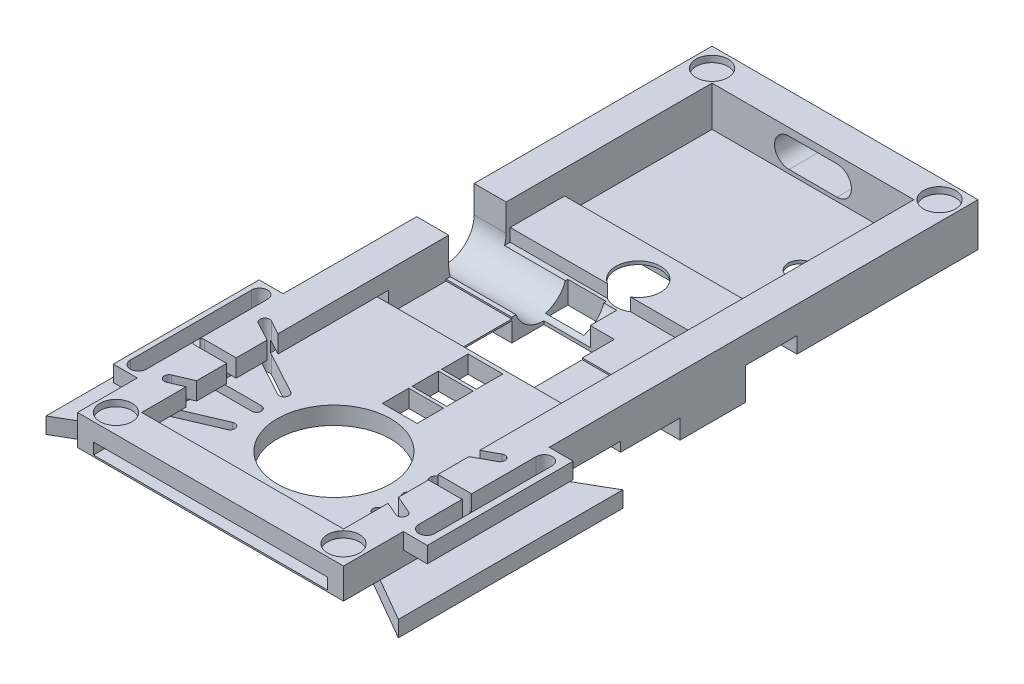
from build123d import *

# Parameters (mm, degrees)
SKETCH2_W            = 83
SKETCH2_H            = 198
BOSS_EXTRUDE5_DEPTH  = 2.5
SKETCH5_W            = 83
SKETCH5_H            = 198
SKETCH5_W_2          = 63
SKETCH5_H_2          = 178
BOSS_EXTRUDE6_DEPTH  = 12
SKETCH6_R            = 5
CUT_EXTRUDE1_DEPTH   = 2
CUT_EXTRUDE2_DEPTH   = 1
SKETCH11_W           = 83
SKETCH11_H           = 198
CUT_EXTRUDE4_DEPTH   = 3
BOSS_EXTRUDE9_DEPTH  = 1
SKETCH14_W           = 83
SKETCH14_H           = 56
BOSS_EXTRUDE10_DEPTH = 1
SKETCH16_W           = 83
SKETCH16_H           = 17
CUT_EXTRUDE6_DEPTH   = 4
SKETCH17_W           = 83
SKETCH17_H           = 17
BOSS_EXTRUDE13_DEPTH = 1
SKETCH19_W           = 83
SKETCH19_H           = 5
BOSS_EXTRUDE18_DEPTH = 0.5
SKETCH20_W           = 83
SKETCH20_H           = 20
BOSS_EXTRUDE22_DEPTH = 7
SKETCH22_W           = 83
SKETCH22_H           = 10
BOSS_EXTRUDE23_DEPTH = 0.5
SKETCH23_W           = 83
SKETCH23_H           = 105
CUT_EXTRUDE8_DEPTH   = 3
SKETCH26_W           = 10
SKETCH26_H           = 18
BOSS_EXTRUDE28_DEPTH = 3.5
SKETCH27_W           = 83
SKETCH27_H           = 18
BOSS_EXTRUDE29_DEPTH = 0.5
SKETCH28_W           = 83
SKETCH28_H           = 87
CUT_EXTRUDE9_DEPTH   = 3
SKETCH29_W           = 5
SKETCH29_H           = 87
BOSS_EXTRUDE34_DEPTH = 3.5
SKETCH30_W           = 5
SKETCH30_H           = 87
BOSS_EXTRUDE35_DEPTH = 3.5
SKETCH31_W           = 83
SKETCH31_H           = 87
BOSS_EXTRUDE36_DEPTH = 0.5
SKETCH32_W           = 83
SKETCH32_H           = 3
BOSS_EXTRUDE37_DEPTH = 0.5
SKETCH33_R           = 18.5
SKETCH33_W           = 12
SKETCH33_H           = 28
BOSS_EXTRUDE39_DEPTH = 5
SKETCH35_R           = 17.671278618
CUT_EXTRUDE11_DEPTH  = 25
SKETCH36_W           = 10.833147776
SKETCH36_H           = 8.25
CUT_EXTRUDE12_DEPTH  = 25
BOSS_EXTRUDE42_DEPTH = 5
SKETCH38_W           = 22
SKETCH38_H           = 28
CUT_EXTRUDE13_DEPTH  = 25
SKETCH39_R           = 7
SKETCH39_W           = 12
SKETCH39_H           = 7
CUT_EXTRUDE14_DEPTH  = 25
SKETCH15_R           = 3.75
CUT_EXTRUDE15_DEPTH  = 25
CUT_EXTRUDE17_DEPTH  = 45
SKETCH41_W           = 45.523641257
SKETCH41_H           = 5
BOSS_EXTRUDE44_DEPTH = 7.5
CUT_EXTRUDE18_DEPTH  = 7.5
SKETCH43_W           = 7.5
SKETCH43_H           = 45.523641257
BOSS_EXTRUDE46_DEPTH = 5
CUT_EXTRUDE19_DEPTH  = 5
CUT_EXTRUDE20_DEPTH  = 15
CUT_EXTRUDE23_DEPTH  = 15


with BuildPart() as part:
    # Sketch2 → Boss-Extrude5 (new body)
    with BuildSketch(Plane(origin=(0, 0, 0), x_dir=(1, 0, 0), z_dir=(0, 1, 0))):
        Rectangle(SKETCH2_W, SKETCH2_H)
    extrude(amount=BOSS_EXTRUDE5_DEPTH)

    # Sketch5 → Boss-Extrude6 (add)
    with BuildSketch(Plane(origin=(0, 2.5, 0), x_dir=(1, 0, 0), z_dir=(0, 1, 0))):
        Rectangle(SKETCH5_W, SKETCH5_H)
        Rectangle(SKETCH5_W_2, SKETCH5_H_2, mode=Mode.SUBTRACT)
    extrude(amount=BOSS_EXTRUDE6_DEPTH)

    # Sketch6 → Cut-Extrude1 (cut)
    with BuildSketch(Plane(origin=(0, 14.5, 0), x_dir=(1, 0, 0), z_dir=(0, 1, 0))):
        with Locations((-35.5, -93)):
            Circle(SKETCH6_R)
        with Locations((35.5, -93)):
            Circle(SKETCH6_R)
        with Locations((35.5, 93)):
            Circle(SKETCH6_R)
        with Locations((-35.5, 93)):
            Circle(SKETCH6_R)
    extrude(amount=-CUT_EXTRUDE1_DEPTH, mode=Mode.SUBTRACT)

    # Sketch9 → Cut-Extrude2 (cut)
    # profile 1 of 11: a face of its own
    with BuildSketch(Plane(origin=(0, 0, 0), x_dir=(-1, 0, 0), z_dir=(0, -1, 0))):
        with BuildLine():
            add(Edge.make_bspline(
                [(-18.430464524, 2.48626712), (-18.370713457, 2.484254645), (-18.251432903, 2.480237158), (-18.074778774, 2.448420071), (-17.900708157, 2.398998196), (-17.790193585, 2.349468415), (-17.734307429, 2.324421681)],
                knots=[0, 0, 0, 0, 0.994543132, 1.985398125, 2.981235217, 4, 4, 4, 4], degree=3))
            add(Edge.make_bspline(
                [(-17.734307429, 2.324421681), (-17.710362074, 2.312833845), (-17.666743069, 2.291725371), (-17.605174928, 2.269965166), (-17.556628328, 2.25250433), (-17.527226937, 2.250069294), (-17.514818409, 2.249041614)],
                knots=[0, 0, 0, 0, 1.366071158, 2.488443524, 3.362064513, 4, 4, 4, 4], degree=3))
            add(Edge.make_bspline(
                [(-17.514818409, 2.249041614), (-17.506182359, 2.249384789), (-17.48660693, 2.250162667), (-17.454154031, 2.255330255), (-17.414787938, 2.261492833), (-17.386677847, 2.268276185), (-17.371448477, 2.271951242)],
                knots=[0, 0, 0, 0, 0.712600479, 1.615259286, 2.708004946, 4, 4, 4, 4], degree=3))
            add(Edge.make_bspline(
                [(-17.371448477, 2.271951242), (-17.360155353, 2.274285058), (-17.336517268, 2.279170061), (-17.312372885, 2.279282647), (-17.299763511, 2.279341445)],
                knots=[0, 0, 0, 0, 0.955502454, 2, 2, 2, 2], degree=3))
            add(Edge.make_bspline(
                [(-17.299763511, 2.279341445), (-17.278857012, 2.277969033), (-17.237296794, 2.275240803), (-17.177607751, 2.251284594), (-17.122521693, 2.212561491), (-17.091905209, 2.17783931), (-17.075840369, 2.159620161)],
                knots=[0, 0, 0, 0, 0.951755322, 1.892002987, 2.893908443, 4, 4, 4, 4], degree=3))
            add(Edge.make_bspline(
                [(-17.075840369, 2.159620161), (-17.056885764, 2.135076295), (-17.019196409, 2.086273247), (-16.971052916, 2.006861849), (-16.929546807, 1.923728168), (-16.896090334, 1.835549279), (-16.870432769, 1.743231843), (-16.851905854, 1.646357819), (-16.840677207, 1.545267841), (-16.839309265, 1.476301555), (-16.838614862, 1.441292458)],
                knots=[0, 0, 0, 0, 0.963401013, 1.91562761, 2.881430175, 3.848567728, 4.842648035, 5.856443937, 6.911874666, 8, 8, 8, 8], degree=3))
            add(Edge.make_bspline(
                [(-16.838614862, 1.441292458), (-16.839083602, 1.416873782), (-16.839987224, 1.369800261), (-16.849713575, 1.301592622), (-16.86627313, 1.238913813), (-16.887036109, 1.180184163), (-16.916738514, 1.127565987), (-16.95110397, 1.078935165), (-16.993273195, 1.036387888), (-17.025035737, 1.012290001), (-17.041106416, 1.000097357)],
                knots=[0, 0, 0, 0, 1.157178249, 2.230770136, 3.256209274, 4.228107424, 5.174189859, 6.110999593, 7.044235235, 8, 8, 8, 8], degree=3))
            add(Edge.make_bspline(
                [(-17.041106416, 1.000097357), (-17.059515893, 0.988658529), (-17.096182637, 0.965875452), (-17.156901899, 0.942353933), (-17.22097423, 0.92775087), (-17.264950047, 0.926227219), (-17.287200166, 0.925456309)],
                knots=[0, 0, 0, 0, 0.994587699, 1.980952045, 2.978437263, 4, 4, 4, 4], degree=3))
            add(Edge.make_bspline(
                [(-17.287200166, 0.925456309), (-17.307189009, 0.926225318), (-17.345198707, 0.927687622), (-17.399637153, 0.937064929), (-17.448053002, 0.95413375), (-17.49196212, 0.978381695), (-17.531654536, 1.012646649), (-17.568685712, 1.057066972), (-17.607044263, 1.11050295), (-17.629331523, 1.151312686), (-17.641190875, 1.1730281)],
                knots=[0, 0, 0, 0, 1.041577197, 1.980606666, 2.865539255, 3.704510443, 4.578768394, 5.579698629, 6.712124829, 8, 8, 8, 8], degree=3))
            add(Edge.make_bspline(
                [(-17.641190875, 1.1730281), (-17.657763947, 1.20342941), (-17.68855454, 1.259911053), (-17.733880445, 1.336899032), (-17.773182875, 1.400843725), (-17.820643816, 1.467473978), (-17.884021187, 1.538821556), (-17.942906458, 1.584803314), (-17.973010977, 1.608311039)],
                knots=[0, 0, 0, 0, 1.127566679, 2.094870931, 2.909569875, 3.570805904, 4.758098266, 6, 6, 6, 6], degree=3))
            add(Edge.make_bspline(
                [(-17.973010977, 1.608311039), (-18.012198305, 1.634244957), (-18.08835995, 1.684648235), (-18.212638042, 1.737227231), (-18.339241078, 1.77099788), (-18.425330481, 1.774877696), (-18.468154558, 1.776807661)],
                knots=[0, 0, 0, 0, 1.05923958, 2.058661118, 3.034305701, 4, 4, 4, 4], degree=3))
            add(Edge.make_bspline(
                [(-18.468154558, 1.776807661), (-18.488626424, 1.776205743), (-18.528504759, 1.775033233), (-18.586775672, 1.76688212), (-18.641813271, 1.752797688), (-18.693813412, 1.732981445), (-18.742118199, 1.706602701), (-18.787712879, 1.675461836), (-18.829757951, 1.638371814), (-18.86837409, 1.595970248), (-18.902701648, 1.549090061), (-18.932737239, 1.498120587), (-18.957676947, 1.443291269), (-18.978563945, 1.384469809), (-18.994460714, 1.321834529), (-19.006611305, 1.255462568), (-19.013021505, 1.18522718), (-19.013860914, 1.137074026), (-19.014290538, 1.112428438)],
                knots=[0, 0, 0, 0, 1.013829975, 1.974898112, 2.907031647, 3.822406359, 4.723109209, 5.626699596, 6.551779913, 7.49313013, 8.461911618, 9.424450048, 10.418036234, 11.440637793, 12.511866762, 13.61513289, 14.779385202, 16, 16, 16, 16], degree=3))
            add(Edge.make_bspline(
                [(-19.014290538, 1.112428438), (-19.013888342, 1.077907239), (-19.013093538, 1.009687699), (-19.001724561, 0.90858428), (-18.986276946, 0.809357353), (-18.961949366, 0.712562897), (-18.932870959, 0.617751611), (-18.896025661, 0.525606972), (-18.853586261, 0.435202494), (-18.819877125, 0.377360185), (-18.80293074, 0.348281478)],
                knots=[0, 0, 0, 0, 1.031247379, 2.03791365, 3.037771106, 4.030691164, 5.018108569, 5.999826826, 6.99446533, 8, 8, 8, 8], degree=3))
            add(Edge.make_bspline(
                [(-18.80293074, 0.348281478), (-18.778725863, 0.311378149), (-18.731523859, 0.239412853), (-18.646727809, 0.145274109), (-18.555639251, 0.064103565), (-18.455484387, -0.001179552), (-18.348113163, -0.053049901), (-18.232572497, -0.089048104), (-18.109328934, -0.110956879), (-18.024589042, -0.113685289), (-17.9811402, -0.115084231)],
                knots=[0, 0, 0, 0, 1.069015146, 2.084689683, 3.062672767, 4.020500115, 4.974537104, 5.945799079, 6.946745732, 8, 8, 8, 8], degree=3))
            add(Edge.make_bspline(
                [(-17.9811402, -0.115084231), (-17.948337675, -0.114171307), (-17.882499351, -0.112338966), (-17.784368483, -0.099334538), (-17.686642614, -0.078695225), (-17.591416222, -0.049216707), (-17.501022688, -0.014243503), (-17.420257299, 0.02737449), (-17.349276115, 0.072525378), (-17.309889842, 0.108989885), (-17.290895267, 0.126575397)],
                knots=[0, 0, 0, 0, 1.052954964, 2.113398045, 3.172867416, 4.256157247, 5.310655612, 6.27984414, 7.170431038, 8, 8, 8, 8], degree=3))
            add(Edge.make_bspline(
                [(-17.290895267, 0.126575397), (-17.276388853, 0.139969021), (-17.249917562, 0.164409692), (-17.210152121, 0.193092737), (-17.174056177, 0.211224599), (-17.150620852, 0.214521645), (-17.140135132, 0.21599685)],
                knots=[0, 0, 0, 0, 1.325197549, 2.418219121, 3.292260257, 4, 4, 4, 4], degree=3))
            add(Edge.make_bspline(
                [(-17.140135132, 0.21599685), (-17.126221293, 0.214949864), (-17.098571679, 0.212869292), (-17.058617294, 0.197483287), (-17.023557742, 0.170183415), (-16.992090676, 0.134809622), (-16.96604861, 0.092461206), (-16.946298067, 0.045196735), (-16.93520315, -0.006676592), (-16.933887721, -0.042608465), (-16.933209456, -0.061135751)],
                knots=[0, 0, 0, 0, 0.872623042, 1.734078476, 2.640170075, 3.636614138, 4.692130371, 5.745946442, 6.837759026, 8, 8, 8, 8], degree=3))
            add(Edge.make_bspline(
                [(-16.933209456, -0.061135751), (-16.934254316, -0.086091153), (-16.936436669, -0.13821439), (-16.953739947, -0.218111767), (-16.981692657, -0.301993182), (-17.018620727, -0.387739815), (-17.062495354, -0.471029606), (-17.111853881, -0.546790292), (-17.166015844, -0.61297254), (-17.20669107, -0.650326601), (-17.226600504, -0.668610413)],
                knots=[0, 0, 0, 0, 0.865314323, 1.807343493, 2.823606105, 3.930165877, 5.042782542, 6.085827563, 7.063063862, 8, 8, 8, 8], degree=3))
            add(Edge.make_bspline(
                [(-17.226600504, -0.668610413), (-17.237218309, -0.675919418), (-17.261711441, -0.692779815), (-17.309703633, -0.71040463), (-17.370231829, -0.729154238), (-17.415918204, -0.738743521), (-17.440916382, -0.743990481)],
                knots=[0, 0, 0, 0, 0.67377611, 1.554265273, 2.661769213, 4, 4, 4, 4], degree=3))
            add(Edge.make_bspline(
                [(-17.440916382, -0.743990481), (-17.457766121, -0.747578593), (-17.494753085, -0.755454878), (-17.552578866, -0.776567627), (-17.618811299, -0.803029525), (-17.664710815, -0.824760706), (-17.689227193, -0.836368015)],
                knots=[0, 0, 0, 0, 0.777438296, 1.706559577, 2.775001235, 4, 4, 4, 4], degree=3))
            add(Edge.make_bspline(
                [(-17.689227193, -0.836368015), (-17.719638191, -0.850468715), (-17.780058337, -0.878483791), (-17.872698274, -0.914923126), (-17.966646193, -0.944909806), (-18.061239192, -0.970418479), (-18.156846108, -0.989359651), (-18.252991897, -1.003679743), (-18.350262111, -1.011848014), (-18.415423404, -1.013102064), (-18.448201011, -1.01373288)],
                knots=[0, 0, 0, 0, 1.023278553, 2.03303558, 3.036724571, 4.032776533, 5.02247644, 6.010574797, 6.999274039, 8, 8, 8, 8], degree=3))
            add(Edge.make_bspline(
                [(-18.448201011, -1.01373288), (-18.516833816, -1.011395559), (-18.654958379, -1.006691666), (-18.861247704, -0.970072329), (-19.067646681, -0.913045672), (-19.200807173, -0.857314631), (-19.268513511, -0.828977812)],
                knots=[0, 0, 0, 0, 0.97206299, 1.956291528, 2.960862834, 4, 4, 4, 4], degree=3))
            add(Edge.make_bspline(
                [(-19.268513511, -0.828977812), (-19.307511435, -0.810630131), (-19.384796166, -0.774269336), (-19.494397315, -0.709133664), (-19.598216484, -0.637695247), (-19.695093104, -0.55806689), (-19.786499462, -0.472159047), (-19.8715721, -0.37885992), (-19.950277435, -0.278360883), (-19.996733553, -0.206600347), (-20.020097125, -0.170510751)],
                knots=[0, 0, 0, 0, 1.01921468, 2.019844185, 3.012565876, 3.998436806, 4.983876906, 5.978171524, 6.983188029, 8, 8, 8, 8], degree=3))
            add(Edge.make_bspline(
                [(-20.020097125, -0.170510751), (-20.041731575, -0.134553141), (-20.084442823, -0.063564767), (-20.140027222, 0.046186995), (-20.186870255, 0.157266366), (-20.224399957, 0.269806164), (-20.254208185, 0.383340943), (-20.275800536, 0.498129128), (-20.288552798, 0.614285752), (-20.290395594, 0.692141793), (-20.291317565, 0.731093978)],
                knots=[0, 0, 0, 0, 1.055267813, 2.083334945, 3.091415004, 4.084839949, 5.064723394, 6.041801365, 7.020292887, 8, 8, 8, 8], degree=3))
            add(Edge.make_bspline(
                [(-20.291317565, 0.731093978), (-20.290406571, 0.776225756), (-20.288598446, 0.865802493), (-20.271563904, 0.998501054), (-20.245050132, 1.128241767), (-20.208142956, 1.255215306), (-20.15963973, 1.378847035), (-20.101344203, 1.499712587), (-20.031389005, 1.617108757), (-19.977792025, 1.691705126), (-19.95062922, 1.729510364)],
                knots=[0, 0, 0, 0, 1.008024733, 2.000709278, 2.984133389, 3.964780855, 4.951173464, 5.948197717, 6.960152152, 8, 8, 8, 8], degree=3))
            add(Edge.make_bspline(
                [(-19.95062922, 1.729510364), (-19.925510593, 1.761712874), (-19.8755091, 1.825815644), (-19.791717052, 1.914251017), (-19.70370817, 1.99823275), (-19.610105102, 2.076542009), (-19.510293748, 2.14842748), (-19.4053199, 2.215068572), (-19.294489917, 2.27586087), (-19.21726075, 2.311101653), (-19.178353038, 2.328855803)],
                knots=[0, 0, 0, 0, 0.991161157, 1.973019346, 2.954622418, 3.944121643, 4.933620867, 5.939242354, 6.961799438, 8, 8, 8, 8], degree=3))
            add(Edge.make_bspline(
                [(-19.178353038, 2.328855803), (-19.117954707, 2.353084038), (-18.997884246, 2.401249198), (-18.811062293, 2.449723447), (-18.621703517, 2.481046104), (-18.494391279, 2.484521856), (-18.430464524, 2.48626712)],
                knots=[0, 0, 0, 0, 1.01399719, 2.015802553, 3.003683334, 4, 4, 4, 4], degree=3))
        make_face()
    # profile 2 of 11: a face of its own
    with BuildSketch(Plane(origin=(0, 0, 0), x_dir=(-1, 0, 0), z_dir=(0, -1, 0))):
        with BuildLine():
            add(Edge.make_bspline(
                [(-14.708019423, 2.48626712), (-14.655503598, 2.485098258), (-14.551673376, 2.482787275), (-14.398715845, 2.465441266), (-14.250722189, 2.437310543), (-14.107702657, 2.398292554), (-13.969602642, 2.347264149), (-13.837262048, 2.283516502), (-13.708381269, 2.211333013), (-13.628515764, 2.153295991), (-13.588403713, 2.124147188)],
                knots=[0, 0, 0, 0, 1.051844963, 2.079626439, 3.079387353, 4.067054608, 5.046041816, 6.023896578, 7.007511949, 8, 8, 8, 8], degree=3))
            add(Edge.make_bspline(
                [(-13.588403713, 2.124147188), (-13.56176406, 2.103050735), (-13.508329719, 2.060735056), (-13.433213531, 1.991141196), (-13.36217307, 1.916668203), (-13.293967204, 1.838729433), (-13.230328625, 1.755183531), (-13.169730466, 1.667651433), (-13.11341533, 1.574998696), (-13.079390148, 1.510692118), (-13.062221281, 1.478243472)],
                knots=[0, 0, 0, 0, 0.970644245, 1.946937291, 2.922621233, 3.910516206, 4.904410596, 5.921583779, 6.951245804, 8, 8, 8, 8], degree=3))
            add(Edge.make_bspline(
                [(-13.062221281, 1.478243472), (-13.046566706, 1.445650153), (-13.015499705, 1.380967675), (-12.976104918, 1.282049313), (-12.941631593, 1.183287248), (-12.91363655, 1.084611585), (-12.891840452, 0.985925326), (-12.877582427, 0.887081081), (-12.867130707, 0.788467071), (-12.866136219, 0.722499369), (-12.865641889, 0.689708843)],
                knots=[0, 0, 0, 0, 1.058036634, 2.099707382, 3.114403172, 4.118670422, 5.100161022, 6.069901926, 7.04060732, 8, 8, 8, 8], degree=3))
            add(Edge.make_bspline(
                [(-12.865641889, 0.689708843), (-12.866685607, 0.641855152), (-12.868754129, 0.547014963), (-12.888110517, 0.406832699), (-12.918128548, 0.27051083), (-12.960679365, 0.137911024), (-13.015252643, 0.009082321), (-13.083317169, -0.115363339), (-13.162240244, -0.23658529), (-13.223387009, -0.312413775), (-13.254366551, -0.350831697)],
                knots=[0, 0, 0, 0, 1.011547597, 2.004764173, 2.986864892, 3.960583769, 4.945650878, 5.941037557, 6.956842404, 8, 8, 8, 8], degree=3))
            add(Edge.make_bspline(
                [(-13.254366551, -0.350831697), (-13.282497531, -0.382536898), (-13.338623668, -0.445794218), (-13.430589358, -0.532980728), (-13.528896333, -0.613144895), (-13.632981171, -0.687289309), (-13.744177172, -0.754017794), (-13.862257423, -0.812578932), (-13.985420196, -0.866651614), (-14.071235185, -0.895630729), (-14.114586146, -0.910270042)],
                knots=[0, 0, 0, 0, 0.977965172, 1.951208449, 2.920924385, 3.903769687, 4.898369367, 5.910384584, 6.944393771, 8, 8, 8, 8], degree=3))
            add(Edge.make_bspline(
                [(-14.114586146, -0.910270042), (-14.168813108, -0.926146374), (-14.276570302, -0.957695053), (-14.440977587, -0.98971982), (-14.605537933, -1.009696807), (-14.715353703, -1.012390211), (-14.770097125, -1.01373288)],
                knots=[0, 0, 0, 0, 1.017501807, 2.021930326, 3.013927564, 4, 4, 4, 4], degree=3))
            add(Edge.make_bspline(
                [(-14.770097125, -1.01373288), (-14.805829769, -1.013102345), (-14.876892859, -1.011848373), (-14.983010996, -1.003670674), (-15.087789594, -0.989442837), (-15.191733428, -0.970405731), (-15.294261883, -0.945073449), (-15.395972564, -0.91478212), (-15.496378496, -0.87870342), (-15.561971227, -0.850501645), (-15.594843747, -0.836368015)],
                knots=[0, 0, 0, 0, 1.009055621, 2.006753535, 3.003359543, 3.993901918, 4.989341907, 5.984125409, 6.989722224, 8, 8, 8, 8], degree=3))
            add(Edge.make_bspline(
                [(-15.594843747, -0.836368015), (-15.633848616, -0.81803209), (-15.711147109, -0.781694591), (-15.820232028, -0.716634436), (-15.923799365, -0.646320713), (-16.020862004, -0.568945739), (-16.110120128, -0.483226773), (-16.194219442, -0.392016808), (-16.272222978, -0.294110537), (-16.317688962, -0.223631367), (-16.3405152, -0.188247238)],
                knots=[0, 0, 0, 0, 1.030857394, 2.04291731, 3.035438857, 4.025155278, 5.009237461, 5.993884518, 6.992827961, 8, 8, 8, 8], degree=3))
            add(Edge.make_bspline(
                [(-16.3405152, -0.188247238), (-16.361471616, -0.153055212), (-16.403066456, -0.083205161), (-16.456188726, 0.026086744), (-16.501587467, 0.137552197), (-16.537600467, 0.252154911), (-16.56668047, 0.369068612), (-16.587499863, 0.489062416), (-16.599207966, 0.611877728), (-16.6011504, 0.694612089), (-16.602128375, 0.73626712)],
                knots=[0, 0, 0, 0, 1.009325406, 2.00333536, 2.992305541, 3.973695717, 4.961975817, 5.960335459, 6.973071281, 8, 8, 8, 8], degree=3))
            add(Edge.make_bspline(
                [(-16.602128375, 0.73626712), (-16.601155595, 0.784590382), (-16.599239605, 0.879767958), (-16.583401054, 1.020438998), (-16.556760933, 1.156565029), (-16.519795694, 1.288584495), (-16.472172002, 1.416311734), (-16.414574202, 1.539735212), (-16.346425207, 1.659172623), (-16.29290539, 1.733894675), (-16.265874152, 1.771634519)],
                knots=[0, 0, 0, 0, 1.046408287, 2.061007504, 3.06133757, 4.047798165, 5.026959698, 6.010371128, 6.995098758, 8, 8, 8, 8], degree=3))
            add(Edge.make_bspline(
                [(-16.265874152, 1.771634519), (-16.24027604, 1.804340754), (-16.189424685, 1.869312592), (-16.104080861, 1.958970448), (-16.013228278, 2.04272397), (-15.915593152, 2.119885381), (-15.810733373, 2.189079052), (-15.700434938, 2.253008225), (-15.583441744, 2.310279031), (-15.501723323, 2.342234655), (-15.460342058, 2.358416614)],
                knots=[0, 0, 0, 0, 0.985888601, 1.958494869, 2.935682924, 3.91884238, 4.910270308, 5.916774205, 6.945078517, 8, 8, 8, 8], degree=3))
            add(Edge.make_bspline(
                [(-15.460342058, 2.358416614), (-15.402555196, 2.378353015), (-15.285612061, 2.418698262), (-15.10083911, 2.457445156), (-14.907471141, 2.481677249), (-14.775346673, 2.484717756), (-14.708019423, 2.48626712)],
                knots=[0, 0, 0, 0, 0.955506866, 1.933656958, 2.94704443, 4, 4, 4, 4], degree=3))
        make_face()
        with BuildLine():
            add(Edge.make_bspline(
                [(-14.920857261, 1.776807661), (-14.936920263, 1.776284843), (-14.968559776, 1.775255043), (-15.014609352, 1.765742461), (-15.058785608, 1.752291455), (-15.099467274, 1.730986084), (-15.137785043, 1.704808336), (-15.17337703, 1.672826095), (-15.206168874, 1.63466008), (-15.225146181, 1.606069786), (-15.234940875, 1.591313573)],
                knots=[0, 0, 0, 0, 1.006775924, 1.983060122, 2.941306894, 3.895429469, 4.851678852, 5.847954811, 6.889272089, 8, 8, 8, 8], degree=3))
            add(Edge.make_bspline(
                [(-15.234940875, 1.591313573), (-15.248817064, 1.567563279), (-15.276835188, 1.519607845), (-15.304277292, 1.439146144), (-15.321855468, 1.352639784), (-15.323998858, 1.292595422), (-15.325101348, 1.261710532)],
                knots=[0, 0, 0, 0, 0.951288008, 1.920794309, 2.930523426, 4, 4, 4, 4], degree=3))
            add(Edge.make_bspline(
                [(-15.325101348, 1.261710532), (-15.323767006, 1.213115541), (-15.320985762, 1.111826248), (-15.298683612, 0.955047354), (-15.26434009, 0.787323827), (-15.217691504, 0.61221419), (-15.161267109, 0.43646415), (-15.096412754, 0.267816163), (-15.024105499, 0.109543895), (-14.969258286, 0.00998828), (-14.942288848, -0.038965143)],
                knots=[0, 0, 0, 0, 0.851887102, 1.775636513, 2.771927568, 3.853257604, 4.951607259, 6.007335301, 7.020168178, 8, 8, 8, 8], degree=3))
            add(Edge.make_bspline(
                [(-14.942288848, -0.038965143), (-14.929593386, -0.058433245), (-14.904659668, -0.096668336), (-14.861659189, -0.148820758), (-14.813827131, -0.194194278), (-14.762747689, -0.233277376), (-14.708677419, -0.264229788), (-14.654079515, -0.287662062), (-14.598354826, -0.301655847), (-14.561028745, -0.30340443), (-14.542478882, -0.30427342)],
                knots=[0, 0, 0, 0, 1.113912043, 2.187708353, 3.232060128, 4.269172407, 5.263986051, 6.211680872, 7.111262858, 8, 8, 8, 8], degree=3))
            add(Edge.make_bspline(
                [(-14.542478882, -0.30427342), (-14.51366307, -0.302725429), (-14.457653493, -0.299716582), (-14.378676073, -0.271602704), (-14.308330303, -0.226909076), (-14.249710187, -0.163599509), (-14.20159705, -0.087155036), (-14.166649655, 0.001738825), (-14.14594377, 0.101730085), (-14.143789192, 0.172045837), (-14.142668916, 0.208606647)],
                knots=[0, 0, 0, 0, 0.946251944, 1.839239202, 2.726048847, 3.66727789, 4.655527083, 5.686138377, 6.796903217, 8, 8, 8, 8], degree=3))
            add(Edge.make_bspline(
                [(-14.142668916, 0.208606647), (-14.143923333, 0.259640512), (-14.146487102, 0.363943237), (-14.164170736, 0.522978371), (-14.193314406, 0.687795529), (-14.233499396, 0.855222755), (-14.281958893, 1.019656636), (-14.337676621, 1.174498338), (-14.401153257, 1.31649011), (-14.449982624, 1.404410129), (-14.473749997, 1.44720462)],
                knots=[0, 0, 0, 0, 0.945659483, 1.932733523, 2.961681864, 4.04567364, 5.121744827, 6.13695095, 7.093173116, 8, 8, 8, 8], degree=3))
            add(Edge.make_bspline(
                [(-14.473749997, 1.44720462), (-14.4888071, 1.471416849), (-14.518136638, 1.518579537), (-14.568798235, 1.582362802), (-14.62280993, 1.638351724), (-14.680343063, 1.685326625), (-14.739176701, 1.724348219), (-14.799416957, 1.75258561), (-14.859920351, 1.771447436), (-14.900779955, 1.77504159), (-14.920857261, 1.776807661)],
                knots=[0, 0, 0, 0, 1.183501978, 2.305328301, 3.376255037, 4.408653338, 5.384967338, 6.300458299, 7.164891106, 8, 8, 8, 8], degree=3))
        make_face(mode=Mode.SUBTRACT)
    # profile 3 of 11: a face of its own
    with BuildSketch(Plane(origin=(0, 0, 0), x_dir=(-1, 0, 0), z_dir=(0, -1, 0))):
        with BuildLine():
            Line((-10.452740706, 1.551406478), (-10.525164693, 1.725076242))
            add(Edge.make_bspline(
                [(-10.525164693, 1.725076242), (-10.536338, 1.754823038), (-10.556892006, 1.809544154), (-10.598095998, 1.879456796), (-10.642353295, 1.933607217), (-10.67894574, 1.955245173), (-10.695878375, 1.96525783)],
                knots=[0, 0, 0, 0, 1.26120691, 2.320069966, 3.222636208, 4, 4, 4, 4], degree=3))
            add(Edge.make_bspline(
                [(-10.695878375, 1.96525783), (-10.710330399, 1.972608245), (-10.737947468, 1.986654507), (-10.775154473, 2.011415087), (-10.807288295, 2.036978621), (-10.833201075, 2.064461352), (-10.854178203, 2.092935624), (-10.867803624, 2.123552737), (-10.877643054, 2.155324956), (-10.878645657, 2.177279681), (-10.879155402, 2.188441951)],
                knots=[0, 0, 0, 0, 1.274788197, 2.436054187, 3.510778093, 4.498034506, 5.401631632, 6.277568582, 7.124277557, 8, 8, 8, 8], degree=3))
            add(Edge.make_bspline(
                [(-10.879155402, 2.188441951), (-10.878490908, 2.20060738), (-10.877186477, 2.224488645), (-10.865239048, 2.259116192), (-10.845827348, 2.291090817), (-10.818073884, 2.320185919), (-10.784016179, 2.347634472), (-10.741899491, 2.372165031), (-10.692052944, 2.392764116), (-10.635502498, 2.413131507), (-10.571273869, 2.430679048), (-10.499042131, 2.444927693), (-10.419778889, 2.458504711), (-10.332667842, 2.468500813), (-10.238276275, 2.476505299), (-10.136264934, 2.482583326), (-10.026583895, 2.48506329), (-9.950946324, 2.485856409), (-9.911777869, 2.48626712)],
                knots=[0, 0, 0, 0, 0.536799426, 1.053760572, 1.601403313, 2.179845644, 2.823226354, 3.531628717, 4.327293706, 5.20629658, 6.18988224, 7.269273785, 8.462547327, 9.746767792, 11.146917289, 12.653435066, 14.267001753, 16, 16, 16, 16], degree=3))
            add(Edge.make_bspline(
                [(-9.911777869, 2.48626712), (-9.872611544, 2.485826316), (-9.796978087, 2.484975086), (-9.687007451, 2.482894115), (-9.584345012, 2.475358274), (-9.4885828, 2.468235978), (-9.400257525, 2.456351346), (-9.318840944, 2.444851108), (-9.245027118, 2.428241422), (-9.198578702, 2.415485417), (-9.1764527, 2.409409012)],
                knots=[0, 0, 0, 0, 1.267529621, 2.447705987, 3.558030398, 4.597996478, 5.554081833, 6.441329293, 7.257517179, 8, 8, 8, 8], degree=3))
            add(Edge.make_bspline(
                [(-9.1764527, 2.409409012), (-9.162751751, 2.404598452), (-9.135826571, 2.395144714), (-9.099008543, 2.375164112), (-9.066384097, 2.351030871), (-9.038786489, 2.32316367), (-9.015546848, 2.293163806), (-8.998816678, 2.260689755), (-8.988862549, 2.226474292), (-8.987794154, 2.203038152), (-8.987263511, 2.191398032)],
                knots=[0, 0, 0, 0, 1.127531642, 2.215831273, 3.24238639, 4.271617853, 5.256038844, 6.181102948, 7.096601288, 8, 8, 8, 8], degree=3))
            add(Edge.make_bspline(
                [(-8.987263511, 2.191398032), (-8.988072799, 2.172999722), (-8.989520268, 2.140093074), (-9.005408671, 2.100625348), (-9.02901684, 2.073556202), (-9.055978774, 2.046298781), (-9.092973059, 2.011087078), (-9.121000717, 1.984935394), (-9.136545605, 1.970430972)],
                knots=[0, 0, 0, 0, 1.190259691, 2.12886165, 2.685812979, 3.511347902, 4.61972704, 6, 6, 6, 6], degree=3))
            add(Edge.make_bspline(
                [(-9.136545605, 1.970430972), (-9.145444085, 1.962069517), (-9.162325933, 1.946206491), (-9.182129264, 1.919591174), (-9.194159875, 1.891319634), (-9.195667716, 1.871997745), (-9.196406247, 1.862534012)],
                knots=[0, 0, 0, 0, 1.150053324, 2.181836378, 3.10947558, 4, 4, 4, 4], degree=3))
            add(Edge.make_bspline(
                [(-9.196406247, 1.862534012), (-9.195235443, 1.845685983), (-9.192523382, 1.80665905), (-9.172543985, 1.742255619), (-9.146931339, 1.662079764), (-9.122562198, 1.604916665), (-9.109201855, 1.573577087)],
                knots=[0, 0, 0, 0, 0.666352318, 1.543544816, 2.653252321, 4, 4, 4, 4], degree=3))
            Line((-9.109201855, 1.573577087), (-8.978395267, 1.266144654))
            add(Edge.make_bspline(
                [(-8.978395267, 1.266144654), (-8.963510966, 1.234793497), (-8.936531372, 1.177965735), (-8.898496861, 1.10268696), (-8.867272498, 1.046385185), (-8.843553829, 1.005608557), (-8.820257712, 0.97879095), (-8.797395177, 0.960563873), (-8.772444635, 0.949076709), (-8.755078635, 0.947620449), (-8.746342902, 0.946887897)],
                knots=[0, 0, 0, 0, 2.027772553, 3.675582807, 4.925337159, 5.791885889, 6.424177819, 6.988433472, 7.491145064, 8, 8, 8, 8], degree=3))
            add(Edge.make_bspline(
                [(-8.746342902, 0.946887897), (-8.736799274, 0.947424133), (-8.717790297, 0.948492206), (-8.691723028, 0.962962964), (-8.667520534, 0.983219536), (-8.645190659, 1.01378602), (-8.623318384, 1.055981782), (-8.598084953, 1.111969193), (-8.570458453, 1.183663548), (-8.551813222, 1.237017365), (-8.541634288, 1.266144654)],
                knots=[0, 0, 0, 0, 0.567355855, 1.130057995, 1.749835203, 2.457435075, 3.384829485, 4.603795269, 6.145920152, 8, 8, 8, 8], degree=3))
            Line((-8.541634288, 1.266144654), (-8.421913004, 1.613484181))
            add(Edge.make_bspline(
                [(-8.421913004, 1.613484181), (-8.414546723, 1.635590505), (-8.400962812, 1.676356036), (-8.385282904, 1.733756904), (-8.374569483, 1.782079046), (-8.373063403, 1.811748438), (-8.372398646, 1.824843978)],
                knots=[0, 0, 0, 0, 1.283049029, 2.366027745, 3.278793834, 4, 4, 4, 4], degree=3))
            add(Edge.make_bspline(
                [(-8.372398646, 1.824843978), (-8.373585795, 1.839373976), (-8.375904517, 1.867753759), (-8.397274161, 1.906547072), (-8.434338166, 1.934672931), (-8.464142232, 1.945880905), (-8.480295605, 1.951955465)],
                knots=[0, 0, 0, 0, 0.964050136, 1.882969018, 2.852599809, 4, 4, 4, 4], degree=3))
            add(Edge.make_bspline(
                [(-8.480295605, 1.951955465), (-8.497940089, 1.957974944), (-8.531447849, 1.969406237), (-8.577184226, 1.991817069), (-8.616283088, 2.017372112), (-8.647522098, 2.047749168), (-8.673523722, 2.079907639), (-8.690655608, 2.116738424), (-8.701399033, 2.156545922), (-8.702772403, 2.184428128), (-8.703479727, 2.198788235)],
                knots=[0, 0, 0, 0, 1.244276815, 2.362943996, 3.394455147, 4.348922122, 5.26398862, 6.139891995, 7.041992967, 8, 8, 8, 8], degree=3))
            add(Edge.make_bspline(
                [(-8.703479727, 2.198788235), (-8.70320054, 2.211158593), (-8.702652308, 2.235449875), (-8.69408181, 2.270029555), (-8.681322606, 2.302386917), (-8.662923592, 2.331590462), (-8.639254487, 2.358044743), (-8.6109888, 2.381832216), (-8.577308181, 2.402526823), (-8.538237132, 2.420279644), (-8.493324871, 2.435531958), (-8.442174551, 2.450008145), (-8.383885706, 2.46016266), (-8.319398529, 2.470127581), (-8.248353594, 2.477322825), (-8.170692067, 2.482112655), (-8.086441559, 2.486320543), (-8.028021242, 2.486285368), (-7.997715369, 2.48626712)],
                knots=[0, 0, 0, 0, 0.703062421, 1.380581478, 2.016553528, 2.678630622, 3.33487959, 4.032173918, 4.776082253, 5.57994236, 6.472195284, 7.47672628, 8.605381787, 9.84007175, 11.194819052, 12.671871152, 14.273514168, 16, 16, 16, 16], degree=3))
            add(Edge.make_bspline(
                [(-7.997715369, 2.48626712), (-7.959021047, 2.485486843), (-7.886181888, 2.48401803), (-7.783481514, 2.475156336), (-7.694393399, 2.458169958), (-7.641107056, 2.440007458), (-7.616380909, 2.43157962)],
                knots=[0, 0, 0, 0, 1.19904627, 2.257114694, 3.19125923, 4, 4, 4, 4], degree=3))
            add(Edge.make_bspline(
                [(-7.616380909, 2.43157962), (-7.60142305, 2.425291032), (-7.572702206, 2.413216205), (-7.533869422, 2.389872338), (-7.500549904, 2.364391912), (-7.472929409, 2.335744986), (-7.452294073, 2.303704848), (-7.437288194, 2.269281271), (-7.427945204, 2.232040575), (-7.426961797, 2.206235185), (-7.4264527, 2.192876073)],
                knots=[0, 0, 0, 0, 1.191518317, 2.287854934, 3.320256395, 4.268199367, 5.197448918, 6.1058178, 7.019406719, 8, 8, 8, 8], degree=3))
            add(Edge.make_bspline(
                [(-7.4264527, 2.192876073), (-7.42768575, 2.170153886), (-7.430068856, 2.126238926), (-7.454043528, 2.074954976), (-7.48275512, 2.037092315), (-7.512257072, 2.004046778), (-7.551185382, 1.967214421), (-7.580543399, 1.94196685), (-7.596427362, 1.928306816)],
                knots=[0, 0, 0, 0, 1.245005409, 2.406210364, 3.047327659, 3.8651028, 4.844927862, 6, 6, 6, 6], degree=3))
            add(Edge.make_bspline(
                [(-7.596427362, 1.928306816), (-7.617188612, 1.909603613), (-7.657040856, 1.873701892), (-7.696752165, 1.816843081), (-7.724212168, 1.761452692), (-7.749031782, 1.70325864), (-7.779102113, 1.628359574), (-7.800036449, 1.572396775), (-7.811482261, 1.541799215)],
                knots=[0, 0, 0, 0, 1.119269065, 2.148492204, 2.759013863, 3.600728486, 4.688202571, 6, 6, 6, 6], degree=3))
            Line((-7.811482261, 1.541799215), (-8.228289693, 0.381537391))
            add(Edge.make_bspline(
                [(-8.228289693, 0.381537391), (-8.241116103, 0.348534285), (-8.266089755, 0.284275615), (-8.302171318, 0.190615995), (-8.336278394, 0.102127691), (-8.368879997, 0.01899341), (-8.398912109, -0.059543252), (-8.428012918, -0.13250055), (-8.454324586, -0.200703431), (-8.479724038, -0.263314142), (-8.502372311, -0.321161491), (-8.523959376, -0.37347022), (-8.543239013, -0.420740302), (-8.559943504, -0.463086829), (-8.575956835, -0.499977023), (-8.588608167, -0.532380589), (-8.600766182, -0.558985715), (-8.629638573, -0.623926908), (-8.678198522, -0.72331275), (-8.730291484, -0.811783048), (-8.755211146, -0.854104501)],
                knots=[0, 0, 0, 0, 1.421642673, 2.768008259, 4.029872038, 5.229254812, 6.353357853, 7.405772461, 8.382897633, 9.288365855, 10.118533477, 10.877089748, 11.56033325, 12.168267021, 12.704647304, 13.174843934, 13.564490767, 13.878820873, 16.02855541, 18, 18, 18, 18], degree=3))
            add(Edge.make_bspline(
                [(-8.755211146, -0.854104501), (-8.764870291, -0.867782462), (-8.783387884, -0.894004544), (-8.813282054, -0.92988179), (-8.847192749, -0.956767137), (-8.881839013, -0.979565745), (-8.921090237, -0.995142962), (-8.965072114, -1.006041634), (-9.014904109, -1.01263284), (-9.050059239, -1.013353639), (-9.06855574, -1.01373288)],
                knots=[0, 0, 0, 0, 1.084416369, 2.078939747, 3.007897823, 3.874991178, 4.75445869, 5.725176289, 6.803125492, 8, 8, 8, 8], degree=3))
            add(Edge.make_bspline(
                [(-9.06855574, -1.01373288), (-9.09323612, -1.012839899), (-9.140194106, -1.011140873), (-9.207305719, -0.999507075), (-9.266829428, -0.978982162), (-9.319692791, -0.949492735), (-9.365742282, -0.909543254), (-9.407336728, -0.859657106), (-9.445962942, -0.799737584), (-9.466495015, -0.754400744), (-9.47723395, -0.730688116)],
                knots=[0, 0, 0, 0, 1.108272326, 2.10864809, 3.046316585, 3.923146037, 4.809899164, 5.767457071, 6.832308148, 8, 8, 8, 8], degree=3))
            Line((-9.47723395, -0.730688116), (-9.973855571, 0.436963911))
            add(Edge.make_bspline(
                [(-9.973855571, 0.436963911), (-9.979889666, 0.451797433), (-9.990741207, 0.478473611), (-10.006908045, 0.513547148), (-10.020973602, 0.539369851), (-10.034691755, 0.562217607), (-10.056744869, 0.581631975), (-10.07813311, 0.583214393), (-10.089142734, 0.584028945)],
                knots=[0, 0, 0, 0, 1.449023839, 2.605882629, 3.493679818, 4.105815713, 5.024966227, 6, 6, 6, 6], degree=3))
            add(Edge.make_bspline(
                [(-10.089142734, 0.584028945), (-10.097653356, 0.583349638), (-10.115024134, 0.581963125), (-10.139566085, 0.568989721), (-10.161038799, 0.547990329), (-10.177561268, 0.525089238), (-10.190888642, 0.500778786), (-10.203008569, 0.475913606), (-10.218177967, 0.445304949), (-10.235008815, 0.40826657), (-10.254074293, 0.365195109), (-10.274718376, 0.315694495), (-10.298573745, 0.260808221), (-10.314389019, 0.221701002), (-10.322673139, 0.201216445)],
                knots=[0, 0, 0, 0, 0.654278619, 1.335428623, 2.089804176, 2.961852438, 3.507370781, 4.231092661, 5.099600653, 6.14742242, 7.3749402, 8.739898359, 10.292342368, 12, 12, 12, 12], degree=3))
            Line((-10.322673139, 0.201216445), (-10.664839524, -0.636093522))
            add(Edge.make_bspline(
                [(-10.664839524, -0.636093522), (-10.679892027, -0.671287845), (-10.707643741, -0.736174249), (-10.752435809, -0.822559155), (-10.79593462, -0.890154493), (-10.841323388, -0.94039353), (-10.892957617, -0.97541611), (-10.953540991, -0.997572208), (-11.024317269, -1.011947567), (-11.075159119, -1.013110935), (-11.102339524, -1.01373288)],
                knots=[0, 0, 0, 0, 1.459965891, 2.691682254, 3.708235155, 4.519411335, 5.257082246, 6.063398588, 6.964679444, 8, 8, 8, 8], degree=3))
            add(Edge.make_bspline(
                [(-11.102339524, -1.01373288), (-11.127045557, -1.013028146), (-11.174195075, -1.011683216), (-11.241002622, -0.997569906), (-11.299643819, -0.973831797), (-11.351455095, -0.940067136), (-11.39722419, -0.893625478), (-11.437543129, -0.832980324), (-11.479131304, -0.760515418), (-11.501369433, -0.705405191), (-11.513234794, -0.676000616)],
                knots=[0, 0, 0, 0, 1.028693485, 1.96318051, 2.828904341, 3.651984682, 4.523293102, 5.526034128, 6.679992506, 8, 8, 8, 8], degree=3))
            Line((-11.513234794, -0.676000616), (-12.43183699, 1.657825397))
            add(Edge.make_bspline(
                [(-12.43183699, 1.657825397), (-12.440468997, 1.682787482), (-12.455678757, 1.726771154), (-12.478412904, 1.783211017), (-12.494390296, 1.822733881), (-12.509079938, 1.849365944), (-12.530032714, 1.866685624), (-12.557530176, 1.885857315), (-12.59691001, 1.908259788), (-12.627128952, 1.92399146), (-12.643935808, 1.932740938)],
                knots=[0, 0, 0, 0, 1.735951012, 3.058778965, 3.994159582, 4.546756123, 5.028117601, 5.760253759, 6.754321258, 8, 8, 8, 8], degree=3))
            add(Edge.make_bspline(
                [(-12.643935808, 1.932740938), (-12.663265509, 1.943974752), (-12.700716662, 1.965740184), (-12.742131421, 2.016280263), (-12.767009821, 2.077688442), (-12.769655355, 2.122173235), (-12.771047294, 2.145578776)],
                knots=[0, 0, 0, 0, 1.017024474, 1.970477356, 2.932172733, 4, 4, 4, 4], degree=3))
            add(Edge.make_bspline(
                [(-12.771047294, 2.145578776), (-12.770336947, 2.159451052), (-12.76894621, 2.186610559), (-12.757928257, 2.225801019), (-12.741138849, 2.262942135), (-12.71515801, 2.295916666), (-12.683518251, 2.32693928), (-12.644808701, 2.354826651), (-12.599012505, 2.379959158), (-12.546567825, 2.402692667), (-12.48698114, 2.422670326), (-12.42038456, 2.439135935), (-12.346982739, 2.45421695), (-12.266707535, 2.465416287), (-12.179515483, 2.475381528), (-12.085317896, 2.481731034), (-11.984018871, 2.485289037), (-11.914279477, 2.485934313), (-11.878310808, 2.48626712)],
                knots=[0, 0, 0, 0, 0.638602024, 1.250271829, 1.865097303, 2.505716395, 3.172389072, 3.903927958, 4.697149355, 5.577115651, 6.536145999, 7.591257307, 8.738458043, 9.989793408, 11.326907056, 12.784374661, 14.341514636, 16, 16, 16, 16], degree=3))
            add(Edge.make_bspline(
                [(-11.878310808, 2.48626712), (-11.841605155, 2.486177504), (-11.770643913, 2.486004254), (-11.668365689, 2.483221346), (-11.573796071, 2.477626504), (-11.487146537, 2.471972257), (-11.408470822, 2.461420391), (-11.337447476, 2.452108432), (-11.274594939, 2.438723036), (-11.235807345, 2.427821285), (-11.217626686, 2.422711377)],
                knots=[0, 0, 0, 0, 1.323083421, 2.557852448, 3.687267559, 4.738098217, 5.686383091, 6.547837182, 7.319337112, 8, 8, 8, 8], degree=3))
            add(Edge.make_bspline(
                [(-11.217626686, 2.422711377), (-11.202147659, 2.417264369), (-11.172286054, 2.406756189), (-11.132431281, 2.384051755), (-11.097459434, 2.358998057), (-11.068860191, 2.329117735), (-11.047296255, 2.294788201), (-11.032488632, 2.256601311), (-11.022355078, 2.21507935), (-11.021492054, 2.185796442), (-11.021047294, 2.170705465)],
                knots=[0, 0, 0, 0, 1.137725096, 2.194859936, 3.173747589, 4.117913958, 5.048489996, 5.970053361, 6.953864952, 8, 8, 8, 8], degree=3))
            add(Edge.make_bspline(
                [(-11.021047294, 2.170705465), (-11.021489412, 2.15396943), (-11.022252662, 2.125077154), (-11.029135672, 2.089528492), (-11.044454809, 2.064508975), (-11.06196276, 2.038963577), (-11.088551774, 2.005895471), (-11.108283067, 1.98079675), (-11.11933699, 1.96673587)],
                knots=[0, 0, 0, 0, 1.293028321, 2.23222112, 2.733727842, 3.5393027, 4.621460833, 6, 6, 6, 6], degree=3))
            add(Edge.make_bspline(
                [(-11.11933699, 1.96673587), (-11.129682145, 1.949966861), (-11.150788995, 1.91575365), (-11.153452122, 1.875611158), (-11.154809963, 1.855143809)],
                knots=[0, 0, 0, 0, 0.980265164, 2, 2, 2, 2], degree=3))
            add(Edge.make_bspline(
                [(-11.154809963, 1.855143809), (-11.15429713, 1.8442806), (-11.15311136, 1.819162762), (-11.144989188, 1.777435875), (-11.13208668, 1.727048247), (-11.114807691, 1.667730102), (-11.093693657, 1.59929307), (-11.066735069, 1.522274537), (-11.034822357, 1.436679855), (-11.01174492, 1.37672916), (-10.999615706, 1.345219823)],
                knots=[0, 0, 0, 0, 0.48762035, 1.127472441, 1.902461197, 2.822820275, 3.899918042, 5.11674816, 6.484598827, 8, 8, 8, 8], degree=3))
            Line((-10.999615706, 1.345219823), (-10.904282092, 1.104299215))
            add(Edge.make_bspline(
                [(-10.904282092, 1.104299215), (-10.894518027, 1.081841412), (-10.877063359, 1.041694864), (-10.852758739, 0.988933279), (-10.833670344, 0.950981594), (-10.817757788, 0.92028224), (-10.79289791, 0.896418983), (-10.768826086, 0.893630696), (-10.756478038, 0.892200397)],
                knots=[0, 0, 0, 0, 1.622110045, 2.899754755, 3.848475101, 4.433442183, 5.196407758, 6, 6, 6, 6], degree=3))
            add(Edge.make_bspline(
                [(-10.756478038, 0.892200397), (-10.748225119, 0.893219517), (-10.730618892, 0.895393638), (-10.704614856, 0.909181858), (-10.679884122, 0.932236335), (-10.654789971, 0.962973435), (-10.629439459, 1.002062699), (-10.60494605, 1.050124995), (-10.5797452, 1.1066955), (-10.563897837, 1.147577359), (-10.555464524, 1.169332999)],
                knots=[0, 0, 0, 0, 0.554845891, 1.183671233, 1.933751375, 2.81485255, 3.842607944, 5.056073934, 6.433363919, 8, 8, 8, 8], degree=3))
            Line((-10.555464524, 1.169332999), (-10.452740706, 1.452377762))
            add(Edge.make_bspline(
                [(-10.452740706, 1.452377762), (-10.449000899, 1.461112093), (-10.442497491, 1.476300823), (-10.440869269, 1.492704411), (-10.440177362, 1.499675059)],
                knots=[0, 0, 0, 0, 1.150106802, 2, 2, 2, 2], degree=3))
            add(Edge.make_bspline(
                [(-10.440177362, 1.499675059), (-10.440849674, 1.507383263), (-10.44240622, 1.525229397), (-10.448996779, 1.541923173), (-10.452740706, 1.551406478)],
                knots=[0, 0, 0, 0, 0.863851429, 2, 2, 2, 2], degree=3))
        make_face()
    # profile 4 of 11: a face of its own
    with BuildSketch(Plane(origin=(0, 0, 0), x_dir=(-1, 0, 0), z_dir=(0, -1, 0))):
        with BuildLine():
            add(Edge.make_bspline(
                [(-7.035510977, 0.870768809), (-7.013815047, 0.870607539), (-6.969111728, 0.870275251), (-6.924637692, 0.865722014), (-6.901748308, 0.863378607)],
                knots=[0, 0, 0, 0, 0.970663066, 2, 2, 2, 2], degree=3))
            add(Edge.make_bspline(
                [(-6.901748308, 0.863378607), (-6.85397135, 0.858560843), (-6.764386288, 0.849527208), (-6.639015741, 0.838927968), (-6.531561903, 0.832655595), (-6.465978757, 0.831422337), (-6.436165538, 0.830861715)],
                knots=[0, 0, 0, 0, 1.234188689, 2.314188182, 3.233652544, 4, 4, 4, 4], degree=3))
            add(Edge.make_bspline(
                [(-6.436165538, 0.830861715), (-6.410792085, 0.831007729), (-6.363728773, 0.831278559), (-6.298628582, 0.833085674), (-6.244894016, 0.837452043), (-6.212969903, 0.841601482), (-6.198940031, 0.843425059)],
                knots=[0, 0, 0, 0, 1.280635831, 2.375355318, 3.286008104, 4, 4, 4, 4], degree=3))
            add(Edge.make_bspline(
                [(-6.198940031, 0.843425059), (-6.185874505, 0.845077956), (-6.162198098, 0.848073216), (-6.130306485, 0.853076116), (-6.105608287, 0.855268514), (-6.091537631, 0.855781694), (-6.085869929, 0.855988404)],
                knots=[0, 0, 0, 0, 1.388301772, 2.515780723, 3.402152111, 4, 4, 4, 4], degree=3))
            add(Edge.make_bspline(
                [(-6.085869929, 0.855988404), (-6.074052982, 0.85477289), (-6.050686065, 0.852369323), (-6.022500285, 0.825191921), (-6.010083911, 0.783278929), (-6.008455965, 0.751852328), (-6.007533781, 0.734050059)],
                knots=[0, 0, 0, 0, 0.85284672, 1.686425276, 2.689426227, 4, 4, 4, 4], degree=3))
            add(Edge.make_bspline(
                [(-6.007533781, 0.734050059), (-6.008206736, 0.713582232), (-6.009655162, 0.669528588), (-6.018911867, 0.599579661), (-6.035134774, 0.521866748), (-6.062465077, 0.407929959), (-6.10678452, 0.262995773), (-6.155046899, 0.151060027), (-6.178986484, 0.095536546)],
                knots=[0, 0, 0, 0, 0.554090663, 1.192589303, 1.906600396, 2.702308873, 4.364246474, 6, 6, 6, 6], degree=3))
            add(Edge.make_bspline(
                [(-6.178986484, 0.095536546), (-6.188380327, 0.076208411), (-6.205684027, 0.04060549), (-6.232525138, -0.006867047), (-6.256051006, -0.044864497), (-6.279136659, -0.072700618), (-6.301253109, -0.093557367), (-6.325509449, -0.106830795), (-6.351091727, -0.115506353), (-6.368845862, -0.116700289), (-6.377782936, -0.117301292)],
                knots=[0, 0, 0, 0, 1.677598463, 3.090179437, 4.25874099, 5.16021784, 5.909475516, 6.615766002, 7.303204515, 8, 8, 8, 8], degree=3))
            add(Edge.make_bspline(
                [(-6.377782936, -0.117301292), (-6.396045002, -0.116655999), (-6.437447406, -0.115193038), (-6.478342516, -0.108486383), (-6.501199321, -0.104737947)],
                knots=[0, 0, 0, 0, 0.882174193, 2, 2, 2, 2], degree=3))
            add(Edge.make_bspline(
                [(-6.501199321, -0.104737947), (-6.540076738, -0.098968195), (-6.620325053, -0.087058636), (-6.745372198, -0.075558243), (-6.878765397, -0.068989458), (-6.970469261, -0.068196156), (-7.01777449, -0.067786934)],
                knots=[0, 0, 0, 0, 0.909581517, 1.87750089, 2.905113665, 4, 4, 4, 4], degree=3))
            add(Edge.make_bspline(
                [(-7.01777449, -0.067786934), (-7.057210764, -0.068021839), (-7.132956472, -0.068473024), (-7.208460251, -0.074503453), (-7.244653713, -0.077394197)],
                knots=[0, 0, 0, 0, 1.04128076, 2, 2, 2, 2], degree=3))
            add(Edge.make_bspline(
                [(-7.244653713, -0.077394197), (-7.268783353, -0.079325333), (-7.310611183, -0.082672884), (-7.352544384, -0.084156607), (-7.370287159, -0.0847844)],
                knots=[0, 0, 0, 0, 1.153760071, 2, 2, 2, 2], degree=3))
            add(Edge.make_bspline(
                [(-7.370287159, -0.0847844), (-7.385738568, -0.083530065), (-7.414752336, -0.081174746), (-7.451901279, -0.054284265), (-7.47098443, -0.009772154), (-7.472759967, 0.023676375), (-7.473749997, 0.042327087)],
                knots=[0, 0, 0, 0, 0.984413467, 1.848475101, 2.800321848, 4, 4, 4, 4], degree=3))
            add(Edge.make_bspline(
                [(-7.473749997, 0.042327087), (-7.472841424, 0.059114217), (-7.470743302, 0.097879874), (-7.458359116, 0.162957248), (-7.439771855, 0.242786084), (-7.414830367, 0.332935519), (-7.386762335, 0.424630082), (-7.357726775, 0.509075227), (-7.330743072, 0.582417396), (-7.309742889, 0.626036513), (-7.300080234, 0.646106647)],
                knots=[0, 0, 0, 0, 0.638775762, 1.475092076, 2.513640922, 3.756826611, 5.031076252, 6.159850502, 7.153305926, 8, 8, 8, 8], degree=3))
            add(Edge.make_bspline(
                [(-7.300080234, 0.646106647), (-7.28921989, 0.665945803), (-7.269103312, 0.702693803), (-7.237910401, 0.751905102), (-7.209093113, 0.791490335), (-7.179808256, 0.821317327), (-7.149104355, 0.843100094), (-7.114856629, 0.857947203), (-7.07666639, 0.867704444), (-7.049613633, 0.869718748), (-7.035510977, 0.870768809)],
                knots=[0, 0, 0, 0, 1.473985225, 2.730257822, 3.796554914, 4.659546915, 5.443628584, 6.234423825, 7.079601584, 8, 8, 8, 8], degree=3))
        make_face()
    # profile 5 of 11: a face of its own
    with BuildSketch(Plane(origin=(0, 0, 0), x_dir=(-1, 0, 0), z_dir=(0, -1, 0))):
        with BuildLine():
            Line((-2.69598395, 0.76361087), (-2.225967058, -0.22224217))
            add(Edge.make_bspline(
                [(-2.225967058, -0.22224217), (-2.215265189, -0.243250326), (-2.19570121, -0.281655126), (-2.166996348, -0.333353085), (-2.14101287, -0.373208816), (-2.116166473, -0.403482285), (-2.088325962, -0.424481324), (-2.056442961, -0.441117724), (-2.018586048, -0.453155308), (-1.991263848, -0.458748046), (-1.976917227, -0.461684738)],
                knots=[0, 0, 0, 0, 1.551249296, 2.835823279, 3.887674552, 4.680507163, 5.396934973, 6.165372046, 7.036654718, 8, 8, 8, 8], degree=3))
            add(Edge.make_bspline(
                [(-1.976917227, -0.461684738), (-1.962798067, -0.464542582), (-1.936072071, -0.469952163), (-1.899067671, -0.482977982), (-1.868354959, -0.501464863), (-1.841333797, -0.522378354), (-1.822331623, -0.550133307), (-1.807690175, -0.580937796), (-1.799838027, -0.616257171), (-1.798677187, -0.640986949), (-1.798074321, -0.653830008)],
                knots=[0, 0, 0, 0, 1.188147728, 2.249031157, 3.214526519, 4.138266139, 5.040746724, 5.959105291, 6.940090305, 8, 8, 8, 8], degree=3))
            add(Edge.make_bspline(
                [(-1.798074321, -0.653830008), (-1.798904578, -0.669136789), (-1.800528221, -0.699070606), (-1.8097839, -0.742971944), (-1.828207511, -0.782751269), (-1.851862664, -0.820079525), (-1.88387022, -0.852267687), (-1.921163023, -0.882859319), (-1.966735044, -0.907767895), (-2.018437905, -0.931272024), (-2.077970558, -0.950848392), (-2.145638394, -0.967829774), (-2.222004693, -0.981450116), (-2.307065817, -0.993158194), (-2.400716579, -1.002755553), (-2.503019145, -1.009268787), (-2.613928068, -1.012757976), (-2.690808441, -1.013399735), (-2.730717902, -1.01373288)],
                knots=[0, 0, 0, 0, 0.669154604, 1.308593315, 1.944310898, 2.573900278, 3.228277189, 3.917118262, 4.673697051, 5.487465847, 6.395791151, 7.405543937, 8.532301338, 9.781375314, 11.154766521, 12.64250922, 14.257088986, 16, 16, 16, 16], degree=3))
            add(Edge.make_bspline(
                [(-2.730717902, -1.01373288), (-2.775797944, -1.013570274), (-2.863007811, -1.013255703), (-2.989416051, -1.011437101), (-3.106890358, -1.006415734), (-3.215368286, -1.002060507), (-3.314587105, -0.994051806), (-3.404876283, -0.986568468), (-3.486214368, -0.976269113), (-3.537260831, -0.967583053), (-3.561376686, -0.963479501)],
                knots=[0, 0, 0, 0, 1.298627189, 2.512267108, 3.641368749, 4.685694753, 5.639232063, 6.5084825, 7.295363112, 8, 8, 8, 8], degree=3))
            add(Edge.make_bspline(
                [(-3.561376686, -0.963479501), (-3.581268656, -0.959169882), (-3.619661226, -0.950852086), (-3.672353292, -0.928783296), (-3.719366306, -0.90215286), (-3.759307974, -0.86901077), (-3.791453631, -0.83040116), (-3.814756644, -0.787499618), (-3.829666338, -0.740772887), (-3.831118641, -0.708137103), (-3.831858105, -0.691520042)],
                knots=[0, 0, 0, 0, 1.166331712, 2.251082908, 3.265109133, 4.259312099, 5.213681381, 6.131398167, 7.048569829, 8, 8, 8, 8], degree=3))
            add(Edge.make_bspline(
                [(-3.831858105, -0.691520042), (-3.831612761, -0.678892597), (-3.831150723, -0.655112348), (-3.822954318, -0.621982263), (-3.812773871, -0.592502776), (-3.79513324, -0.567664813), (-3.771736891, -0.545196812), (-3.740409923, -0.525100012), (-3.701251696, -0.505950454), (-3.67232225, -0.494479719), (-3.656710301, -0.488289468)],
                knots=[0, 0, 0, 0, 1.033850522, 1.946967429, 2.792556998, 3.578404304, 4.422782253, 5.44427952, 6.620790129, 8, 8, 8, 8], degree=3))
            add(Edge.make_bspline(
                [(-3.656710301, -0.488289468), (-3.639750351, -0.481204958), (-3.608984796, -0.468353572), (-3.572270184, -0.439380027), (-3.547894733, -0.404766234), (-3.545538027, -0.378518354), (-3.54437922, -0.365612103)],
                knots=[0, 0, 0, 0, 1.237427521, 2.244708448, 3.136911835, 4, 4, 4, 4], degree=3))
            add(Edge.make_bspline(
                [(-3.54437922, -0.365612103), (-3.544839216, -0.353717846), (-3.545728224, -0.330730463), (-3.555600913, -0.298378956), (-3.571820495, -0.270167147), (-3.593417338, -0.245104443), (-3.622624219, -0.225097576), (-3.65770128, -0.209099744), (-3.698719355, -0.196503855), (-3.728317342, -0.191580654), (-3.743914693, -0.188986258)],
                knots=[0, 0, 0, 0, 0.963872175, 1.8628232, 2.714186135, 3.593318169, 4.526154204, 5.564623422, 6.716621363, 8, 8, 8, 8], degree=3))
            add(Edge.make_bspline(
                [(-3.743914693, -0.188986258), (-3.783299648, -0.184688467), (-3.869300056, -0.175303872), (-4.009898843, -0.168328881), (-4.172254543, -0.162817658), (-4.287826716, -0.162532755), (-4.349172294, -0.162381528)],
                knots=[0, 0, 0, 0, 0.7841553, 1.712269956, 2.785675469, 4, 4, 4, 4], degree=3))
            add(Edge.make_bspline(
                [(-4.349172294, -0.162381528), (-4.375037597, -0.162593335), (-4.424308963, -0.16299681), (-4.49405531, -0.16410001), (-4.555386441, -0.16729483), (-4.60842649, -0.170574723), (-4.653267371, -0.175884785), (-4.690142244, -0.181287817), (-4.71878681, -0.188222309), (-4.734261707, -0.1949773), (-4.740853038, -0.197854501)],
                knots=[0, 0, 0, 0, 1.570802418, 2.992255056, 4.235321687, 5.300065585, 6.218574218, 6.976054928, 7.563863906, 8, 8, 8, 8], degree=3))
            add(Edge.make_bspline(
                [(-4.740853038, -0.197854501), (-4.753865337, -0.207546352), (-4.782684285, -0.229011348), (-4.811773121, -0.277674372), (-4.835155606, -0.331411382), (-4.838354332, -0.370064506), (-4.839881754, -0.388521731)],
                knots=[0, 0, 0, 0, 0.867762476, 1.921874156, 3.007675644, 4, 4, 4, 4], degree=3))
            add(Edge.make_bspline(
                [(-4.839881754, -0.388521731), (-4.83933448, -0.398726043), (-4.83836617, -0.416780873), (-4.822298945, -0.436506825), (-4.800008634, -0.444473172), (-4.772301433, -0.454961886), (-4.733725544, -0.470786857), (-4.703705117, -0.481535245), (-4.686904558, -0.487550447)],
                knots=[0, 0, 0, 0, 0.919306443, 1.626559585, 2.17364659, 3.069232284, 4.359832271, 6, 6, 6, 6], degree=3))
            add(Edge.make_bspline(
                [(-4.686904558, -0.487550447), (-4.675437015, -0.491925841), (-4.653337955, -0.500357645), (-4.623434588, -0.517543697), (-4.598004048, -0.537663233), (-4.576512763, -0.560698758), (-4.561329255, -0.588128885), (-4.549011368, -0.617711502), (-4.542539809, -0.650847914), (-4.541734169, -0.673759874), (-4.541317565, -0.68560788)],
                knots=[0, 0, 0, 0, 1.109490257, 2.138094521, 3.105962601, 4.037195274, 4.966290865, 5.926684947, 6.927867883, 8, 8, 8, 8], degree=3))
            add(Edge.make_bspline(
                [(-4.541317565, -0.68560788), (-4.541912588, -0.698951426), (-4.543070193, -0.724911004), (-4.551349929, -0.762670646), (-4.565493246, -0.797560066), (-4.585156838, -0.829825894), (-4.609912057, -0.859810876), (-4.640455241, -0.887311182), (-4.676855029, -0.911283558), (-4.718379066, -0.933220943), (-4.765612154, -0.951892129), (-4.818100594, -0.969018273), (-4.87617256, -0.983005217), (-4.939687071, -0.993714503), (-5.008475901, -1.002513404), (-5.082656022, -1.009309599), (-5.162554928, -1.012736048), (-5.21776479, -1.013392884), (-5.246342902, -1.01373288)],
                knots=[0, 0, 0, 0, 0.744158931, 1.447744989, 2.144452154, 2.835032806, 3.547687444, 4.306673216, 5.118561788, 5.973066851, 6.922433416, 7.948112059, 9.051416016, 10.25116308, 11.539864336, 12.919725915, 14.405567108, 16, 16, 16, 16], degree=3))
            add(Edge.make_bspline(
                [(-5.246342902, -1.01373288), (-5.278617438, -1.01368322), (-5.340964449, -1.01358729), (-5.431125192, -1.010262014), (-5.514718645, -1.00640974), (-5.591496775, -0.999100205), (-5.661954587, -0.992710198), (-5.725437882, -0.981866265), (-5.782520577, -0.970530684), (-5.817899416, -0.960720866), (-5.834603038, -0.956089299)],
                knots=[0, 0, 0, 0, 1.30634612, 2.52356154, 3.651964203, 4.69290921, 5.645465716, 6.514330931, 7.298562215, 8, 8, 8, 8], degree=3))
            add(Edge.make_bspline(
                [(-5.834603038, -0.956089299), (-5.848349963, -0.951095153), (-5.874675706, -0.941531227), (-5.909890498, -0.920757452), (-5.940961482, -0.897775802), (-5.964849642, -0.8683372), (-5.984427666, -0.835946556), (-5.997628935, -0.798736676), (-6.005831753, -0.757899135), (-6.006953429, -0.729251755), (-6.007533781, -0.71442967)],
                knots=[0, 0, 0, 0, 1.090263859, 2.087885422, 3.045131436, 3.959481521, 4.900128182, 5.860906481, 6.893238246, 8, 8, 8, 8], degree=3))
            add(Edge.make_bspline(
                [(-6.007533781, -0.71442967), (-6.007238914, -0.701571008), (-6.006677555, -0.677091017), (-5.998944855, -0.642739384), (-5.987606814, -0.612475838), (-5.969580451, -0.586854055), (-5.944983384, -0.564733092), (-5.914193815, -0.543358164), (-5.874830679, -0.524664598), (-5.84624009, -0.513013213), (-5.830907936, -0.506764974)],
                knots=[0, 0, 0, 0, 1.038291422, 1.976672511, 2.835455346, 3.637287795, 4.483485343, 5.50090057, 6.659818599, 8, 8, 8, 8], degree=3))
            add(Edge.make_bspline(
                [(-5.830907936, -0.506764974), (-5.805282644, -0.496230982), (-5.756271803, -0.476083708), (-5.689333505, -0.438161646), (-5.63284831, -0.39434004), (-5.592083847, -0.352601433), (-5.562177392, -0.313500942), (-5.538282724, -0.276780851), (-5.51244867, -0.232592171), (-5.483748587, -0.181905406), (-5.452452556, -0.123885586), (-5.419510663, -0.058545855), (-5.384847516, 0.014403367), (-5.360877439, 0.065230475), (-5.3483277, 0.091841445)],
                knots=[0, 0, 0, 0, 1.254563077, 2.399472722, 3.47335629, 4.483702101, 5.032888104, 5.701553417, 6.467234692, 7.351883775, 8.340668076, 9.453799114, 10.666914658, 12, 12, 12, 12], degree=3))
            Line((-5.3483277, 0.091841445), (-4.998032092, 0.843425059))
            add(Edge.make_bspline(
                [(-4.998032092, 0.843425059), (-4.982448669, 0.876897813), (-4.952486852, 0.941254951), (-4.910145407, 1.034883343), (-4.871701331, 1.122085194), (-4.837040156, 1.202821191), (-4.806789545, 1.277095314), (-4.779694911, 1.344322118), (-4.757783801, 1.405627304), (-4.733192882, 1.477927937), (-4.707697262, 1.563399314), (-4.687565008, 1.665144938), (-4.673387967, 1.765582455), (-4.671058791, 1.832434168), (-4.669907092, 1.865490093)],
                knots=[0, 0, 0, 0, 1.228608371, 2.362211354, 3.419224203, 4.399763267, 5.285695025, 6.087880885, 6.81131854, 7.451585028, 8.629346067, 9.775563366, 10.900090834, 12, 12, 12, 12], degree=3))
            add(Edge.make_bspline(
                [(-4.669907092, 1.865490093), (-4.669425207, 1.897765369), (-4.668541645, 1.956943913), (-4.663795594, 2.037657134), (-4.655749067, 2.102283191), (-4.646013843, 2.154268682), (-4.629078695, 2.19802075), (-4.606020187, 2.238439363), (-4.575835585, 2.27856521), (-4.551271309, 2.302810996), (-4.538361484, 2.315553438)],
                knots=[0, 0, 0, 0, 1.594623916, 2.923833144, 3.991009749, 4.812068535, 5.528521039, 6.296840392, 7.104899585, 8, 8, 8, 8], degree=3))
            add(Edge.make_bspline(
                [(-4.538361484, 2.315553438), (-4.523854541, 2.329179862), (-4.49507747, 2.356210269), (-4.44730352, 2.390848019), (-4.397068616, 2.420874445), (-4.343156325, 2.444191638), (-4.287034981, 2.463873811), (-4.227510553, 2.477080999), (-4.165087129, 2.484258167), (-4.12255718, 2.485588487), (-4.100861484, 2.48626712)],
                knots=[0, 0, 0, 0, 0.989210821, 1.962273613, 2.929065756, 3.894614437, 4.878955268, 5.883830572, 6.920483757, 8, 8, 8, 8], degree=3))
            add(Edge.make_bspline(
                [(-4.100861484, 2.48626712), (-4.079895303, 2.485693652), (-4.038266266, 2.484555013), (-3.9760286, 2.475499421), (-3.914947968, 2.459482237), (-3.853905695, 2.43938182), (-3.794702291, 2.410998175), (-3.735138674, 2.378867411), (-3.67675854, 2.339428054), (-3.639500469, 2.309424236), (-3.620498308, 2.29412185)],
                knots=[0, 0, 0, 0, 0.952345845, 1.890913809, 2.849094479, 3.81883948, 4.80529607, 5.827115769, 6.891797267, 8, 8, 8, 8], degree=3))
            add(Edge.make_bspline(
                [(-3.620498308, 2.29412185), (-3.606818969, 2.281945549), (-3.577653379, 2.255984572), (-3.534094914, 2.211637573), (-3.489091637, 2.158731757), (-3.442176357, 2.097838122), (-3.391544376, 2.030181461), (-3.340165169, 1.953422948), (-3.285573707, 1.869505904), (-3.228660569, 1.777989606), (-3.170151681, 1.678226746), (-3.109089806, 1.570791563), (-3.045635137, 1.455438601), (-2.979444396, 1.332475825), (-2.912173923, 1.201286074), (-2.841321439, 1.062670398), (-2.769341988, 0.915866479), (-2.720803843, 0.815124897), (-2.69598395, 0.76361087)],
                knots=[0, 0, 0, 0, 0.489223549, 1.043068895, 1.659157019, 2.343785313, 3.096755631, 3.91641444, 4.810951161, 5.771638313, 6.795454461, 7.900815786, 9.073253921, 10.312948371, 11.631730857, 13.012235712, 14.472212097, 16, 16, 16, 16], degree=3))
        make_face()
        with BuildLine():
            Line((-4.408293916, 0.452483337), (-3.989269423, 0.452483337))
            add(Edge.make_bspline(
                [(-3.989269423, 0.452483337), (-3.972362616, 0.452597787), (-3.943214995, 0.452795101), (-3.908335249, 0.457280649), (-3.88277431, 0.459525973), (-3.876221771, 0.469148218), (-3.873982261, 0.472436884)],
                knots=[0, 0, 0, 0, 1.669560639, 2.878350811, 3.616645615, 4, 4, 4, 4], degree=3))
            add(Edge.make_bspline(
                [(-3.873982261, 0.472436884), (-3.874444372, 0.480856582), (-3.875520529, 0.500464234), (-3.885077154, 0.532807615), (-3.897458543, 0.57306792), (-3.915194166, 0.620715508), (-3.938958387, 0.675687451), (-3.965383646, 0.739147584), (-3.999563751, 0.80921408), (-4.023295384, 0.858685229), (-4.0358277, 0.884810195)],
                knots=[0, 0, 0, 0, 0.453589848, 1.056312494, 1.808652888, 2.729454809, 3.795663254, 5.039823509, 6.436775569, 8, 8, 8, 8], degree=3))
            add(Edge.make_bspline(
                [(-4.0358277, 0.884810195), (-4.046316854, 0.907274671), (-4.06556824, 0.948505098), (-4.093197421, 1.003975941), (-4.117758872, 1.046909475), (-4.137877713, 1.079592516), (-4.15683281, 1.103010925), (-4.175733182, 1.119175541), (-4.19539585, 1.129999707), (-4.209377753, 1.131106829), (-4.216148646, 1.131642965)],
                knots=[0, 0, 0, 0, 1.874915164, 3.441146432, 4.684238361, 5.614356338, 6.341820865, 6.950033589, 7.491542058, 8, 8, 8, 8], degree=3))
            add(Edge.make_bspline(
                [(-4.216148646, 1.131642965), (-4.228021671, 1.12923085), (-4.254737006, 1.123803383), (-4.286993864, 1.086871261), (-4.313853827, 1.032968926), (-4.32791301, 0.989325033), (-4.335869929, 0.964624384)],
                knots=[0, 0, 0, 0, 0.654804832, 1.473367514, 2.570029907, 4, 4, 4, 4], degree=3))
            add(Edge.make_bspline(
                [(-4.335869929, 0.964624384), (-4.338103902, 0.958225281), (-4.344446059, 0.94005849), (-4.356000341, 0.904410581), (-4.374060658, 0.853200853), (-4.386969097, 0.813407531), (-4.394252531, 0.79095462)],
                knots=[0, 0, 0, 0, 0.443897845, 1.260207774, 2.454104652, 4, 4, 4, 4], degree=3))
            add(Edge.make_bspline(
                [(-4.394252531, 0.79095462), (-4.403274863, 0.771313905), (-4.420224326, 0.734416617), (-4.44191311, 0.681177046), (-4.462436747, 0.635397422), (-4.477737446, 0.594720404), (-4.490786899, 0.560999955), (-4.498257556, 0.532773863), (-4.505563592, 0.511714846), (-4.50628589, 0.499077447), (-4.506583612, 0.493868472)],
                knots=[0, 0, 0, 0, 1.628170328, 3.058700699, 4.330808198, 5.406141206, 6.333747151, 7.050155173, 7.608485986, 8, 8, 8, 8], degree=3))
            add(Edge.make_bspline(
                [(-4.506583612, 0.493868472), (-4.505302176, 0.48751674), (-4.502460327, 0.473430455), (-4.479435067, 0.459980965), (-4.447684753, 0.454164708), (-4.422656419, 0.45309639), (-4.408293916, 0.452483337)],
                knots=[0, 0, 0, 0, 0.642837769, 1.425626392, 2.522696426, 4, 4, 4, 4], degree=3))
        make_face(mode=Mode.SUBTRACT)
    # profile 6 of 11: a face of its own
    with BuildSketch(Plane(origin=(0, 0, 0), x_dir=(-1, 0, 0), z_dir=(0, -1, 0))):
        with BuildLine():
            add(Edge.make_bspline(
                [(-1.359835301, 0.870768809), (-1.338139371, 0.870607539), (-1.293436052, 0.870275251), (-1.248962016, 0.865722014), (-1.226072632, 0.863378607)],
                knots=[0, 0, 0, 0, 0.970663066, 2, 2, 2, 2], degree=3))
            add(Edge.make_bspline(
                [(-1.226072632, 0.863378607), (-1.178295675, 0.858560843), (-1.088710612, 0.849527208), (-0.963340065, 0.838927968), (-0.855886228, 0.832655595), (-0.790303081, 0.831422337), (-0.760489862, 0.830861715)],
                knots=[0, 0, 0, 0, 1.234188689, 2.314188182, 3.233652544, 4, 4, 4, 4], degree=3))
            add(Edge.make_bspline(
                [(-0.760489862, 0.830861715), (-0.73511641, 0.831007729), (-0.688053097, 0.831278559), (-0.622952906, 0.833085674), (-0.56921834, 0.837452043), (-0.537294228, 0.841601482), (-0.523264355, 0.843425059)],
                knots=[0, 0, 0, 0, 1.280635831, 2.375355318, 3.286008104, 4, 4, 4, 4], degree=3))
            add(Edge.make_bspline(
                [(-0.523264355, 0.843425059), (-0.510198829, 0.845077956), (-0.486522423, 0.848073216), (-0.454630809, 0.853076116), (-0.429932612, 0.855268514), (-0.415861955, 0.855781694), (-0.410194254, 0.855988404)],
                knots=[0, 0, 0, 0, 1.388301772, 2.515780723, 3.402152111, 4, 4, 4, 4], degree=3))
            add(Edge.make_bspline(
                [(-0.410194254, 0.855988404), (-0.398377307, 0.85477289), (-0.37501039, 0.852369323), (-0.346824609, 0.825191921), (-0.334408235, 0.783278929), (-0.33278029, 0.751852328), (-0.331858105, 0.734050059)],
                knots=[0, 0, 0, 0, 0.85284672, 1.686425276, 2.689426227, 4, 4, 4, 4], degree=3))
            add(Edge.make_bspline(
                [(-0.331858105, 0.734050059), (-0.332531061, 0.713582232), (-0.333979487, 0.669528588), (-0.343236192, 0.599579661), (-0.359459098, 0.521866748), (-0.386789401, 0.407929959), (-0.431108844, 0.262995773), (-0.479371223, 0.151060027), (-0.503310808, 0.095536546)],
                knots=[0, 0, 0, 0, 0.554090663, 1.192589303, 1.906600396, 2.702308873, 4.364246474, 6, 6, 6, 6], degree=3))
            add(Edge.make_bspline(
                [(-0.503310808, 0.095536546), (-0.512704651, 0.076208411), (-0.530008351, 0.04060549), (-0.556849462, -0.006867047), (-0.58037533, -0.044864497), (-0.603460984, -0.072700618), (-0.625577434, -0.093557367), (-0.649833773, -0.106830795), (-0.675416051, -0.115506353), (-0.693170187, -0.116700289), (-0.702107261, -0.117301292)],
                knots=[0, 0, 0, 0, 1.677598463, 3.090179437, 4.25874099, 5.16021784, 5.909475516, 6.615766002, 7.303204515, 8, 8, 8, 8], degree=3))
            add(Edge.make_bspline(
                [(-0.702107261, -0.117301292), (-0.720369326, -0.116655999), (-0.76177173, -0.115193038), (-0.802666841, -0.108486383), (-0.825523646, -0.104737947)],
                knots=[0, 0, 0, 0, 0.882174193, 2, 2, 2, 2], degree=3))
            add(Edge.make_bspline(
                [(-0.825523646, -0.104737947), (-0.864401062, -0.098968195), (-0.944649378, -0.087058636), (-1.069696522, -0.075558243), (-1.203089721, -0.068989458), (-1.294793585, -0.068196156), (-1.342098815, -0.067786934)],
                knots=[0, 0, 0, 0, 0.909581517, 1.87750089, 2.905113665, 4, 4, 4, 4], degree=3))
            add(Edge.make_bspline(
                [(-1.342098815, -0.067786934), (-1.381535089, -0.068021839), (-1.457280796, -0.068473024), (-1.532784575, -0.074503453), (-1.568978038, -0.077394197)],
                knots=[0, 0, 0, 0, 1.04128076, 2, 2, 2, 2], degree=3))
            add(Edge.make_bspline(
                [(-1.568978038, -0.077394197), (-1.593107677, -0.079325333), (-1.634935507, -0.082672884), (-1.676868709, -0.084156607), (-1.694611484, -0.0847844)],
                knots=[0, 0, 0, 0, 1.153760071, 2, 2, 2, 2], degree=3))
            add(Edge.make_bspline(
                [(-1.694611484, -0.0847844), (-1.710062892, -0.083530065), (-1.73907666, -0.081174746), (-1.776225603, -0.054284265), (-1.795308754, -0.009772154), (-1.797084292, 0.023676375), (-1.798074321, 0.042327087)],
                knots=[0, 0, 0, 0, 0.984413467, 1.848475101, 2.800321848, 4, 4, 4, 4], degree=3))
            add(Edge.make_bspline(
                [(-1.798074321, 0.042327087), (-1.797165748, 0.059114217), (-1.795067626, 0.097879874), (-1.78268344, 0.162957248), (-1.764096179, 0.242786084), (-1.739154692, 0.332935519), (-1.711086659, 0.424630082), (-1.682051099, 0.509075227), (-1.655067397, 0.582417396), (-1.634067213, 0.626036513), (-1.624404558, 0.646106647)],
                knots=[0, 0, 0, 0, 0.638775762, 1.475092076, 2.513640922, 3.756826611, 5.031076252, 6.159850502, 7.153305926, 8, 8, 8, 8], degree=3))
            add(Edge.make_bspline(
                [(-1.624404558, 0.646106647), (-1.613544214, 0.665945803), (-1.593427637, 0.702693803), (-1.562234725, 0.751905102), (-1.533417438, 0.791490335), (-1.50413258, 0.821317327), (-1.47342868, 0.843100094), (-1.439180954, 0.857947203), (-1.400990714, 0.867704444), (-1.373937958, 0.869718748), (-1.359835301, 0.870768809)],
                knots=[0, 0, 0, 0, 1.473985225, 2.730257822, 3.796554914, 4.659546915, 5.443628584, 6.234423825, 7.079601584, 8, 8, 8, 8], degree=3))
        make_face()
    # profile 7 of 11: a face of its own
    with BuildSketch(Plane(origin=(0, 0, 0), x_dir=(-1, 0, 0), z_dir=(0, -1, 0))):
        with BuildLine():
            Line((1.163918922, -0.966435582), (0.837271962, -0.970130684))
            add(Edge.make_bspline(
                [(0.837271962, -0.970130684), (0.783813643, -0.971519851), (0.684518985, -0.974100119), (0.547272018, -0.978939319), (0.433181903, -0.985344024), (0.365028142, -0.991183888), (0.334738179, -0.993779332)],
                knots=[0, 0, 0, 0, 1.275302031, 2.368773995, 3.275024946, 4, 4, 4, 4], degree=3))
            add(Edge.make_bspline(
                [(0.334738179, -0.993779332), (0.312832069, -0.99688514), (0.272527519, -1.002599444), (0.216796452, -1.008371959), (0.171222641, -1.01242029), (0.144076406, -1.01333449), (0.132246625, -1.01373288)],
                knots=[0, 0, 0, 0, 1.304013154, 2.399224044, 3.302414108, 4, 4, 4, 4], degree=3))
            add(Edge.make_bspline(
                [(0.132246625, -1.01373288), (0.10849688, -1.012814881), (0.063201657, -1.011064085), (-0.000715477, -0.995804941), (-0.057708238, -0.972096692), (-0.088931497, -0.947470593), (-0.104239862, -0.935396731)],
                knots=[0, 0, 0, 0, 1.118165596, 2.132551809, 3.084414013, 4, 4, 4, 4], degree=3))
            add(Edge.make_bspline(
                [(-0.104239862, -0.935396731), (-0.117462868, -0.922124706), (-0.143051323, -0.896441394), (-0.169856726, -0.849902988), (-0.187355797, -0.800162575), (-0.189088802, -0.76532412), (-0.189966213, -0.747685582)],
                knots=[0, 0, 0, 0, 1.053859029, 2.03937155, 3.007343509, 4, 4, 4, 4], degree=3))
            add(Edge.make_bspline(
                [(-0.189966213, -0.747685582), (-0.189082261, -0.726315985), (-0.187488217, -0.687779906), (-0.169159911, -0.641659612), (-0.142499237, -0.610942455), (-0.114972021, -0.581487386), (-0.076217587, -0.547773769), (-0.047595386, -0.523244255), (-0.031815875, -0.509721055)],
                knots=[0, 0, 0, 0, 1.284217385, 2.315846317, 2.907307771, 3.726710071, 4.74672797, 6, 6, 6, 6], degree=3))
            add(Edge.make_bspline(
                [(-0.031815875, -0.509721055), (-0.021987513, -0.500505565), (-0.001693465, -0.481477003), (0.020663016, -0.443933442), (0.039358696, -0.400498724), (0.050764923, -0.358374725), (0.058202007, -0.318170993), (0.064001867, -0.279706841), (0.070016426, -0.233395582), (0.075400878, -0.179359305), (0.082730341, -0.117643079), (0.087893578, -0.048302196), (0.095012118, 0.02874012), (0.099074989, 0.082719667), (0.101207773, 0.111055972)],
                knots=[0, 0, 0, 0, 0.745850222, 1.540065303, 2.405175224, 3.372276277, 3.957911744, 4.678558303, 5.534839785, 6.554356046, 7.697907377, 8.990120889, 10.419978363, 12, 12, 12, 12], degree=3))
            add(Edge.make_bspline(
                [(0.101207773, 0.111055972), (0.104539529, 0.158344899), (0.111391031, 0.255590985), (0.119421949, 0.405634254), (0.125713503, 0.563813452), (0.132246028, 0.729821177), (0.134968076, 0.903783665), (0.139593416, 1.085556138), (0.140408348, 1.275505754), (0.140876096, 1.404834683), (0.141114868, 1.470853269)],
                knots=[0, 0, 0, 0, 0.836156596, 1.719492484, 2.65015169, 3.62840209, 4.649716157, 5.718815266, 6.8355228, 8, 8, 8, 8], degree=3))
            add(Edge.make_bspline(
                [(0.141114868, 1.470853269), (0.140932391, 1.494502765), (0.140582608, 1.539835387), (0.139076189, 1.604629193), (0.137059216, 1.663285653), (0.133665855, 1.715579809), (0.127987914, 1.761556637), (0.123360492, 1.80162284), (0.116981766, 1.835553461), (0.106180694, 1.872282857), (0.087126164, 1.913053899), (0.052389419, 1.956000153), (0.007008192, 1.99461434), (-0.029187445, 2.014659113), (-0.048074321, 2.025118472)],
                knots=[0, 0, 0, 0, 1.360810844, 2.608475216, 3.729055499, 4.737926317, 5.622319059, 6.394137794, 7.058520006, 7.605657028, 8.594717521, 9.624091132, 10.760251232, 12, 12, 12, 12], degree=3))
            add(Edge.make_bspline(
                [(-0.048074321, 2.025118472), (-0.06951582, 2.037391343), (-0.109793658, 2.060445923), (-0.156645374, 2.109620181), (-0.185315265, 2.16847258), (-0.188393643, 2.211038587), (-0.189966213, 2.232783168)],
                knots=[0, 0, 0, 0, 1.111080281, 2.087163474, 3.022839347, 4, 4, 4, 4], degree=3))
            add(Edge.make_bspline(
                [(-0.189966213, 2.232783168), (-0.18898297, 2.250711559), (-0.187054502, 2.285875108), (-0.166992399, 2.335484995), (-0.136245597, 2.380024983), (-0.093094569, 2.417459274), (-0.041428685, 2.448547618), (0.018530784, 2.470461569), (0.085084098, 2.484007617), (0.131684827, 2.485494593), (0.155895273, 2.48626712)],
                knots=[0, 0, 0, 0, 0.896467075, 1.758270667, 2.647362111, 3.593850659, 4.604044985, 5.661346514, 6.785000924, 8, 8, 8, 8], degree=3))
            add(Edge.make_bspline(
                [(0.155895273, 2.48626712), (0.170681591, 2.485895887), (0.202507295, 2.485096853), (0.253024602, 2.481139121), (0.309517608, 2.475410418), (0.348802556, 2.469449749), (0.369472131, 2.466313573)],
                knots=[0, 0, 0, 0, 0.826657769, 1.779277797, 2.831578314, 4, 4, 4, 4], degree=3))
            add(Edge.make_bspline(
                [(0.369472131, 2.466313573), (0.406154892, 2.462150498), (0.480892983, 2.453668578), (0.595250275, 2.444945344), (0.713803468, 2.439616189), (0.794156622, 2.439187843), (0.835054902, 2.438969823)],
                knots=[0, 0, 0, 0, 0.949232205, 1.933982083, 2.948434809, 4, 4, 4, 4], degree=3))
            add(Edge.make_bspline(
                [(0.835054902, 2.438969823), (0.852298881, 2.439194873), (0.890485637, 2.439693247), (0.953073542, 2.441023525), (1.026707631, 2.444395505), (1.111477172, 2.447736126), (1.207518212, 2.453318865), (1.314709661, 2.458891065), (1.43291951, 2.466610417), (1.515444971, 2.471755196), (1.558555746, 2.474442796)],
                knots=[0, 0, 0, 0, 0.571319851, 1.2651866, 2.073772863, 3.013160635, 4.075611864, 5.260739039, 6.569027543, 8, 8, 8, 8], degree=3))
            add(Edge.make_bspline(
                [(1.558555746, 2.474442796), (1.612239432, 2.477888829), (1.714372094, 2.484444871), (1.816705131, 2.48568082), (1.865249158, 2.48626712)],
                knots=[0, 0, 0, 0, 1.051254034, 2, 2, 2, 2], degree=3))
            add(Edge.make_bspline(
                [(1.865249158, 2.48626712), (1.916987503, 2.485443781), (2.015387154, 2.483877897), (2.155235155, 2.475348082), (2.279060282, 2.457230786), (2.389177965, 2.434247942), (2.487920849, 2.40173245), (2.579037766, 2.361190261), (2.663138296, 2.31006146), (2.713597038, 2.268858783), (2.738771118, 2.248302593)],
                knots=[0, 0, 0, 0, 1.340507845, 2.54947285, 3.626142806, 4.579967551, 5.459836637, 6.313846072, 7.15877068, 8, 8, 8, 8], degree=3))
            add(Edge.make_bspline(
                [(2.738771118, 2.248302593), (2.757914485, 2.230485105), (2.795774534, 2.195247261), (2.844921324, 2.135417333), (2.886111086, 2.070965436), (2.920800263, 2.002607169), (2.946238791, 1.929350846), (2.965881702, 1.852319013), (2.976883759, 1.770473943), (2.97825283, 1.714514758), (2.978952706, 1.685908168)],
                knots=[0, 0, 0, 0, 0.99309997, 1.96406481, 2.932724981, 3.895713127, 4.869967321, 5.873602593, 6.912975928, 8, 8, 8, 8], degree=3))
            add(Edge.make_bspline(
                [(2.978952706, 1.685908168), (2.978085428, 1.657038943), (2.976349136, 1.599242709), (2.962657952, 1.512956398), (2.939570742, 1.42784751), (2.908037669, 1.345218768), (2.869498731, 1.267089107), (2.823292336, 1.196688968), (2.771727541, 1.133311529), (2.731417187, 1.098107947), (2.711427368, 1.080650566)],
                knots=[0, 0, 0, 0, 1.014963416, 2.031958424, 3.063826532, 4.111288325, 5.138015564, 6.120818879, 7.068118068, 8, 8, 8, 8], degree=3))
            add(Edge.make_bspline(
                [(2.711427368, 1.080650566), (2.698113291, 1.069533005), (2.673852793, 1.049274932), (2.647404402, 1.01511597), (2.6273823, 0.983882993), (2.62522553, 0.961654655), (2.624222976, 0.951322019)],
                knots=[0, 0, 0, 0, 1.290846579, 2.352140518, 3.234007888, 4, 4, 4, 4], degree=3))
            add(Edge.make_bspline(
                [(2.624222976, 0.951322019), (2.625599206, 0.940900816), (2.628458073, 0.919252669), (2.6510639, 0.890486905), (2.684232396, 0.864716897), (2.712285911, 0.851925115), (2.727685814, 0.8449031)],
                knots=[0, 0, 0, 0, 0.792580058, 1.646440405, 2.708019694, 4, 4, 4, 4], degree=3))
            add(Edge.make_bspline(
                [(2.727685814, 0.8449031), (2.760920508, 0.829510652), (2.828362383, 0.798275356), (2.922589295, 0.734149622), (3.012014052, 0.655811745), (3.065811037, 0.595248081), (3.093500848, 0.564075397)],
                knots=[0, 0, 0, 0, 0.942902348, 1.913395116, 2.926004963, 4, 4, 4, 4], degree=3))
            add(Edge.make_bspline(
                [(3.093500848, 0.564075397), (3.107214643, 0.546623465), (3.13446501, 0.511945131), (3.168033241, 0.454866478), (3.19833334, 0.395819396), (3.221578719, 0.332639604), (3.240224598, 0.266440277), (3.253586281, 0.196994874), (3.260703155, 0.124260162), (3.262050718, 0.074857956), (3.262736489, 0.049717289)],
                knots=[0, 0, 0, 0, 0.962768402, 1.91309494, 2.869901871, 3.841485013, 4.830404108, 5.854232234, 6.908023786, 8, 8, 8, 8], degree=3))
            add(Edge.make_bspline(
                [(3.262736489, 0.049717289), (3.262180762, 0.019612102), (3.261077929, -0.04013123), (3.247484717, -0.128566433), (3.227960292, -0.215256514), (3.199694606, -0.299912806), (3.162911177, -0.382179751), (3.119516735, -0.463253147), (3.066771759, -0.541566203), (3.02663353, -0.591061765), (3.006296456, -0.616139974)],
                knots=[0, 0, 0, 0, 0.990241483, 1.965120632, 2.938919732, 3.913461495, 4.897473201, 5.902646026, 6.937321226, 8, 8, 8, 8], degree=3))
            add(Edge.make_bspline(
                [(3.006296456, -0.616139974), (2.977026241, -0.647996921), (2.918798646, -0.711370332), (2.817277545, -0.792045289), (2.706871881, -0.861646602), (2.58517181, -0.916603555), (2.454301036, -0.960741592), (2.312965738, -0.990996115), (2.161678866, -1.011042685), (2.057217014, -1.012818692), (2.003445949, -1.01373288)],
                knots=[0, 0, 0, 0, 0.930441812, 1.850939244, 2.78274124, 3.734624135, 4.719394076, 5.751702089, 6.842703129, 8, 8, 8, 8], degree=3))
            add(Edge.make_bspline(
                [(2.003445949, -1.01373288), (1.994575642, -1.013825765), (1.974114176, -1.014040026), (1.93916328, -1.011869811), (1.896028841, -1.010889165), (1.844550687, -1.008421891), (1.784933486, -1.00553312), (1.716944888, -1.001793209), (1.640825268, -0.997363007), (1.587376399, -0.994044704), (1.559294766, -0.992301292)],
                knots=[0, 0, 0, 0, 0.478591821, 1.103985487, 1.888794826, 2.806962421, 3.885106227, 5.109979162, 6.481604832, 8, 8, 8, 8], degree=3))
            add(Edge.make_bspline(
                [(1.559294766, -0.992301292), (1.533678625, -0.990528323), (1.485159936, -0.987170202), (1.416386427, -0.983154289), (1.355614206, -0.978086589), (1.302348765, -0.975534081), (1.256757005, -0.972809215), (1.218897387, -0.969181107), (1.188780288, -0.96823747), (1.17130657, -0.96697102), (1.163918922, -0.966435582)],
                knots=[0, 0, 0, 0, 1.555287316, 2.945818318, 4.17260517, 5.248568417, 6.175589085, 6.938893239, 7.551378607, 8, 8, 8, 8], degree=3))
        make_face()
        with BuildLine():
            Line((1.276250003, 1.781241782), (1.276250003, 1.249886208))
            add(Edge.make_bspline(
                [(1.276250003, 1.249886208), (1.27669469, 1.230413315), (1.277518922, 1.194320105), (1.282845362, 1.144657285), (1.292871531, 1.1042277), (1.30690326, 1.072107719), (1.326712196, 1.047524601), (1.353876661, 1.031857111), (1.385798539, 1.021046774), (1.409416594, 1.020394124), (1.421836996, 1.020050904)],
                knots=[0, 0, 0, 0, 1.494070314, 2.769274862, 3.82354237, 4.677544388, 5.442181491, 6.197418887, 7.052048002, 8, 8, 8, 8], degree=3))
            add(Edge.make_bspline(
                [(1.421836996, 1.020050904), (1.452054497, 1.021265789), (1.50922914, 1.023564476), (1.588531493, 1.046044309), (1.655890413, 1.082775905), (1.709214168, 1.137003563), (1.749678431, 1.206635459), (1.776862639, 1.292065785), (1.793636689, 1.393094979), (1.795514009, 1.465850459), (1.796520273, 1.504848201)],
                knots=[0, 0, 0, 0, 1.030122686, 1.949098884, 2.789376218, 3.622458901, 4.512942466, 5.516212747, 6.668662569, 8, 8, 8, 8], degree=3))
            add(Edge.make_bspline(
                [(1.796520273, 1.504848201), (1.795567389, 1.5431216), (1.793766635, 1.615450381), (1.775677243, 1.717042449), (1.74796523, 1.805947069), (1.706031297, 1.880114502), (1.654229659, 1.940340004), (1.590639226, 1.982937249), (1.517201409, 2.009472712), (1.464688887, 2.011985997), (1.437356422, 2.013294147)],
                knots=[0, 0, 0, 0, 1.307834692, 2.471536172, 3.518754957, 4.477184642, 5.366601905, 6.21029726, 7.068470014, 8, 8, 8, 8], degree=3))
            add(Edge.make_bspline(
                [(1.437356422, 2.013294147), (1.423238908, 2.012919305), (1.397073182, 2.012224565), (1.361286789, 2.002373953), (1.331755154, 1.986842384), (1.308943112, 1.963120551), (1.293293226, 1.930904225), (1.283755041, 1.889603289), (1.277190286, 1.838847732), (1.276580156, 1.801468421), (1.276250003, 1.781241782)],
                knots=[0, 0, 0, 0, 1.028309962, 1.905893314, 2.68722984, 3.438129377, 4.26713054, 5.271057795, 6.52331876, 8, 8, 8, 8], degree=3))
        make_face(mode=Mode.SUBTRACT)
        with BuildLine():
            Line((1.276250003, 0.317981647), (1.276250003, 0.071148877))
            add(Edge.make_bspline(
                [(1.276250003, 0.071148877), (1.27641389, 0.044052162), (1.276728314, -0.007934208), (1.278482534, -0.082395687), (1.283520742, -0.149839231), (1.28781342, -0.210367809), (1.29576562, -0.263482236), (1.3030847, -0.309629176), (1.313663302, -0.348358353), (1.328323274, -0.389847675), (1.355410135, -0.432751809), (1.403504134, -0.468851477), (1.464167606, -0.490832642), (1.508837759, -0.492547133), (1.532690037, -0.493462609)],
                knots=[0, 0, 0, 0, 1.380391305, 2.648348101, 3.792740424, 4.825459317, 5.737623445, 6.527780061, 7.203537108, 7.779265484, 8.767733173, 9.73404864, 10.790062324, 12, 12, 12, 12], degree=3))
            add(Edge.make_bspline(
                [(1.532690037, -0.493462609), (1.564609767, -0.492187952), (1.6248323, -0.489783073), (1.70924696, -0.468072231), (1.781522185, -0.431842514), (1.840083906, -0.378900768), (1.885379444, -0.311683873), (1.916867815, -0.230191753), (1.934833673, -0.134582066), (1.93716915, -0.066390588), (1.938412165, -0.0300969)],
                knots=[0, 0, 0, 0, 1.085161302, 2.047359509, 2.943860368, 3.811006822, 4.704284967, 5.679228558, 6.764811112, 8, 8, 8, 8], degree=3))
            add(Edge.make_bspline(
                [(1.938412165, -0.0300969), (1.938291214, -0.006678612), (1.938057788, 0.038517036), (1.931688122, 0.103877891), (1.922779274, 0.164771291), (1.911781935, 0.221690474), (1.894877306, 0.273532384), (1.87628207, 0.321581319), (1.852054535, 0.364035627), (1.826438114, 0.40344013), (1.79605188, 0.437583026), (1.761382202, 0.466268375), (1.724573783, 0.492130496), (1.683080004, 0.511681294), (1.638788933, 0.528449144), (1.590247158, 0.539081666), (1.538552929, 0.545898227), (1.502906387, 0.546678431), (1.484653719, 0.547077931)],
                knots=[0, 0, 0, 0, 1.3392739, 2.584704355, 3.752763199, 4.861221681, 5.895415897, 6.869059011, 7.802706403, 8.686173934, 9.554674044, 10.404678553, 11.256900418, 12.12046876, 13.021194235, 13.96141445, 14.956150482, 16, 16, 16, 16], degree=3))
            add(Edge.make_bspline(
                [(1.484653719, 0.547077931), (1.466622033, 0.546661714), (1.432966173, 0.545884852), (1.386872006, 0.536532369), (1.349268412, 0.521219475), (1.319605148, 0.49874347), (1.298858844, 0.466672439), (1.285372185, 0.425584839), (1.277824455, 0.37491444), (1.276802562, 0.337962383), (1.276250003, 0.317981647)],
                knots=[0, 0, 0, 0, 1.188129464, 2.217625055, 3.083992147, 3.847979287, 4.632265635, 5.562576583, 6.682035137, 8, 8, 8, 8], degree=3))
        make_face(mode=Mode.SUBTRACT)
    # profile 8 of 11: a face of its own
    with BuildSketch(Plane(origin=(0, 0, 0), x_dir=(-1, 0, 0), z_dir=(0, -1, 0))):
        with BuildLine():
            Line((7.046520273, 1.197415769), (7.046520273, 0.592158168))
            add(Edge.make_bspline(
                [(7.046520273, 0.592158168), (7.046181938, 0.548307839), (7.045529854, 0.463793643), (7.042105011, 0.341799844), (7.03539995, 0.229685862), (7.02666943, 0.127648735), (7.015902694, 0.03561332), (7.002097482, -0.046331), (6.985446627, -0.118484465), (6.971176807, -0.162462889), (6.964489023, -0.183074096)],
                knots=[0, 0, 0, 0, 1.344732378, 2.591747444, 3.741996797, 4.78841022, 5.73195967, 6.582671205, 7.335745707, 8, 8, 8, 8], degree=3))
            add(Edge.make_bspline(
                [(6.964489023, -0.183074096), (6.948486433, -0.222229326), (6.916624727, -0.300188732), (6.851045998, -0.408631884), (6.773217417, -0.508897325), (6.681726803, -0.600751195), (6.577265809, -0.684106011), (6.459440413, -0.75927761), (6.328011861, -0.824845516), (6.234406784, -0.86125726), (6.186300679, -0.879970211)],
                knots=[0, 0, 0, 0, 0.93871332, 1.869010392, 2.805166776, 3.753454596, 4.742524668, 5.768981711, 6.853421138, 8, 8, 8, 8], degree=3))
            add(Edge.make_bspline(
                [(6.186300679, -0.879970211), (6.124077255, -0.900678772), (5.997303079, -0.942870452), (5.796299338, -0.983738376), (5.583944138, -1.0095352), (5.438245922, -1.01231299), (5.363771118, -1.01373288)],
                knots=[0, 0, 0, 0, 0.938973649, 1.913067499, 2.933247819, 4, 4, 4, 4], degree=3))
            add(Edge.make_bspline(
                [(5.363771118, -1.01373288), (5.298694388, -1.012660896), (5.171737052, -1.010569576), (4.986278593, -0.992454447), (4.810586579, -0.963250956), (4.644701478, -0.921963581), (4.488527395, -0.869140547), (4.343330038, -0.802535241), (4.20663225, -0.726362782), (4.123591952, -0.66508074), (4.082309969, -0.634615481)],
                knots=[0, 0, 0, 0, 1.146887801, 2.237448317, 3.281122936, 4.283728673, 5.247714551, 6.182434806, 7.096430328, 8, 8, 8, 8], degree=3))
            add(Edge.make_bspline(
                [(4.082309969, -0.634615481), (4.045451186, -0.603276968), (3.973556645, -0.542149936), (3.882826654, -0.436619987), (3.809334053, -0.324359309), (3.763074027, -0.223235564), (3.736246015, -0.136504941), (3.717399055, -0.06511289), (3.702151013, 0.013411843), (3.689826546, 0.098760618), (3.680158068, 0.190962342), (3.673955102, 0.289836025), (3.669177042, 0.395533071), (3.668702852, 0.468243064), (3.668458618, 0.505692796)],
                knots=[0, 0, 0, 0, 1.376233547, 2.684398938, 3.947382072, 5.187652958, 5.835563631, 6.531566699, 7.289720259, 8.112273296, 8.987029239, 9.929295608, 10.93347088, 12, 12, 12, 12], degree=3))
            add(Edge.make_bspline(
                [(3.668458618, 0.505692796), (3.668401931, 0.521951637), (3.668279964, 0.5569344), (3.669348224, 0.61309555), (3.669806444, 0.676658366), (3.671361733, 0.747360496), (3.673784015, 0.825437944), (3.675954562, 0.91067331), (3.67798122, 1.003308614), (3.679982672, 1.067349634), (3.681021962, 1.100604114)],
                knots=[0, 0, 0, 0, 0.65572948, 1.410877273, 2.265370417, 3.219365715, 4.262997418, 5.415877012, 6.658146525, 8, 8, 8, 8], degree=3))
            add(Edge.make_bspline(
                [(3.681021962, 1.100604114), (3.681502275, 1.124006708), (3.682417417, 1.168595842), (3.683919707, 1.232397342), (3.685339135, 1.290043168), (3.686954915, 1.341517253), (3.687932213, 1.386847324), (3.687311548, 1.425779737), (3.688612345, 1.458531228), (3.688474284, 1.478242777), (3.688412165, 1.487111715)],
                knots=[0, 0, 0, 0, 1.45314883, 2.768695108, 3.961934527, 5.032875417, 5.965868566, 6.776393052, 7.449455066, 8, 8, 8, 8], degree=3))
            add(Edge.make_bspline(
                [(3.688412165, 1.487111715), (3.6878587, 1.518885575), (3.686845303, 1.577063696), (3.68290364, 1.656752656), (3.67250758, 1.720215686), (3.659664291, 1.771357559), (3.638004543, 1.813530865), (3.607594959, 1.851230885), (3.568475323, 1.887957227), (3.537717327, 1.909489241), (3.521393584, 1.920916614)],
                knots=[0, 0, 0, 0, 1.548976585, 2.836185047, 3.88214687, 4.680231356, 5.394261667, 6.172323433, 7.030023822, 8, 8, 8, 8], degree=3))
            add(Edge.make_bspline(
                [(3.521393584, 1.920916614), (3.496620668, 1.938152202), (3.450549767, 1.970205721), (3.398579754, 2.029769699), (3.36344052, 2.092375151), (3.359337125, 2.137043815), (3.357331084, 2.158881141)],
                knots=[0, 0, 0, 0, 1.198633105, 2.229132328, 3.134269778, 4, 4, 4, 4], degree=3))
            add(Edge.make_bspline(
                [(3.357331084, 2.158881141), (3.358310608, 2.174781391), (3.360237948, 2.206067209), (3.376244555, 2.25104251), (3.400923053, 2.293293152), (3.436441232, 2.331231685), (3.478646453, 2.365903112), (3.528680744, 2.39391125), (3.584047402, 2.417360899), (3.624178386, 2.426751735), (3.644809969, 2.43157962)],
                knots=[0, 0, 0, 0, 0.88863173, 1.748498904, 2.645665108, 3.613124913, 4.643520691, 5.694692113, 6.814827228, 8, 8, 8, 8], degree=3))
            add(Edge.make_bspline(
                [(3.644809969, 2.43157962), (3.689813939, 2.43992938), (3.783374505, 2.457288031), (3.930898142, 2.47492722), (4.090325913, 2.483838517), (4.200543173, 2.485440091), (4.257457773, 2.48626712)],
                knots=[0, 0, 0, 0, 0.891374996, 1.853115361, 2.891379812, 4, 4, 4, 4], degree=3))
            add(Edge.make_bspline(
                [(4.257457773, 2.48626712), (4.319559438, 2.485698614), (4.438221203, 2.48461233), (4.60794082, 2.472642584), (4.761404863, 2.453771284), (4.857163489, 2.433210913), (4.902622469, 2.423450397)],
                knots=[0, 0, 0, 0, 1.146950716, 2.191554737, 3.141486467, 4, 4, 4, 4], degree=3))
            add(Edge.make_bspline(
                [(4.902622469, 2.423450397), (4.922498234, 2.418319565), (4.960339326, 2.40855107), (5.012170758, 2.386115837), (5.055809927, 2.358742856), (5.092971261, 2.327508129), (5.120077582, 2.289745514), (5.140895316, 2.248288454), (5.152882102, 2.201416708), (5.154031478, 2.168556298), (5.154628381, 2.151490938)],
                knots=[0, 0, 0, 0, 1.213892521, 2.311107006, 3.326690945, 4.256803329, 5.163880673, 6.057375596, 6.991139073, 8, 8, 8, 8], degree=3))
            add(Edge.make_bspline(
                [(5.154628381, 2.151490938), (5.153701686, 2.134924019), (5.151919536, 2.103063807), (5.140330962, 2.057335752), (5.118373197, 2.017378502), (5.098196104, 1.995434547), (5.088116557, 1.984472357)],
                knots=[0, 0, 0, 0, 1.07591295, 2.069112137, 3.035417245, 4, 4, 4, 4], degree=3))
            add(Edge.make_bspline(
                [(5.088116557, 1.984472357), (5.083463616, 1.980985296), (5.070553818, 1.971310287), (5.044590103, 1.954460667), (5.005789931, 1.932630592), (4.975804641, 1.916199731), (4.95878801, 1.906875228)],
                knots=[0, 0, 0, 0, 0.462112091, 1.282151132, 2.457622691, 4, 4, 4, 4], degree=3))
            add(Edge.make_bspline(
                [(4.95878801, 1.906875228), (4.947800984, 1.900236591), (4.925869902, 1.886985279), (4.899411839, 1.857340625), (4.878669152, 1.821062623), (4.862648946, 1.776366112), (4.853549714, 1.720633951), (4.844973264, 1.651909713), (4.84138269, 1.568189216), (4.840837928, 1.507310175), (4.840544766, 1.47454837)],
                knots=[0, 0, 0, 0, 0.653481225, 1.30440669, 2.004563989, 2.781766698, 3.718299765, 4.885719752, 6.324062905, 8, 8, 8, 8], degree=3))
            add(Edge.make_bspline(
                [(4.840544766, 1.47454837), (4.84058508, 1.453855651), (4.840676268, 1.407049529), (4.839795972, 1.328957992), (4.838354096, 1.23510088), (4.835871928, 1.12573529), (4.833924057, 1.000584792), (4.830902437, 0.859678631), (4.827003029, 0.702770293), (4.824736459, 0.592898159), (4.8235473, 0.535253607)],
                knots=[0, 0, 0, 0, 0.528621163, 1.19572041, 1.995044361, 2.926615831, 3.99031882, 5.192566212, 6.527076342, 8, 8, 8, 8], degree=3))
            add(Edge.make_bspline(
                [(4.8235473, 0.535253607), (4.823098517, 0.500493407), (4.822224406, 0.43278979), (4.83246778, 0.334673468), (4.848811695, 0.242623241), (4.874999539, 0.157209845), (4.908859307, 0.077715522), (4.951226254, 0.004518213), (5.002352137, -0.061749517), (5.042295389, -0.100272469), (5.062250848, -0.119518353)],
                knots=[0, 0, 0, 0, 1.157113578, 2.253749239, 3.280616008, 4.267076914, 5.222852327, 6.153206284, 7.07735067, 8, 8, 8, 8], degree=3))
            add(Edge.make_bspline(
                [(5.062250848, -0.119518353), (5.079645801, -0.134504695), (5.114197187, -0.164271887), (5.172117649, -0.200911779), (5.232678658, -0.233157088), (5.297529643, -0.258720166), (5.365320538, -0.279856995), (5.43725627, -0.293402024), (5.512561225, -0.302729318), (5.564261531, -0.303751619), (5.590650341, -0.30427342)],
                knots=[0, 0, 0, 0, 0.960801689, 1.908428852, 2.864116309, 3.832043532, 4.824641507, 5.83474115, 6.894811127, 8, 8, 8, 8], degree=3))
            add(Edge.make_bspline(
                [(5.590650341, -0.30427342), (5.624205514, -0.303528062), (5.689900871, -0.302068777), (5.78572759, -0.287515733), (5.876577548, -0.264543615), (5.962225391, -0.233373289), (6.039960264, -0.192617388), (6.10976896, -0.146323046), (6.169259303, -0.0919489), (6.200934328, -0.050070539), (6.21660051, -0.02935788)],
                knots=[0, 0, 0, 0, 1.133621984, 2.219440191, 3.267662107, 4.297867409, 5.292315466, 6.227726256, 7.123449395, 8, 8, 8, 8], degree=3))
            add(Edge.make_bspline(
                [(6.21660051, -0.02935788), (6.227545235, -0.012817211), (6.249440601, 0.020273067), (6.275896251, 0.073605724), (6.296719973, 0.12963315), (6.312597433, 0.189517198), (6.323491595, 0.256604092), (6.331227457, 0.333105177), (6.336568828, 0.42063174), (6.336890499, 0.482527856), (6.337060814, 0.515300059)],
                knots=[0, 0, 0, 0, 0.838263489, 1.676980111, 2.511089256, 3.362778147, 4.292878181, 5.382502665, 6.614110878, 8, 8, 8, 8], degree=3))
            Line((6.337060814, 0.515300059), (6.337060814, 1.065131141))
            add(Edge.make_bspline(
                [(6.337060814, 1.065131141), (6.336155789, 1.115139811), (6.334448125, 1.20949964), (6.330816817, 1.34302442), (6.326306852, 1.460027772), (6.321881381, 1.560784325), (6.317704478, 1.64506395), (6.3128799, 1.713119927), (6.306910728, 1.764852024), (6.300167234, 1.812143171), (6.283254326, 1.859014167), (6.24784554, 1.905371942), (6.199281277, 1.946263468), (6.159492382, 1.965878302), (6.138264361, 1.976343134)],
                knots=[0, 0, 0, 0, 1.826607112, 3.446569027, 4.878001723, 6.10269112, 7.129690894, 7.959744477, 8.593586018, 9.03136576, 9.703144406, 10.385086695, 11.138417568, 12, 12, 12, 12], degree=3))
            add(Edge.make_bspline(
                [(6.138264361, 1.976343134), (6.118186891, 1.985447533), (6.080737396, 2.002429511), (6.030939121, 2.029506753), (5.990825921, 2.054679544), (5.959861731, 2.078986921), (5.938084053, 2.1057789), (5.921977937, 2.134019221), (5.913061428, 2.165749385), (5.911950141, 2.187652304), (5.911385138, 2.198788235)],
                knots=[0, 0, 0, 0, 1.562707252, 2.914839274, 4.014651531, 4.9203682, 5.689671905, 6.447992126, 7.210924677, 8, 8, 8, 8], degree=3))
            add(Edge.make_bspline(
                [(5.911385138, 2.198788235), (5.911980031, 2.210909), (5.913147238, 2.234690465), (5.921513009, 2.268884911), (5.93481558, 2.301057182), (5.955262455, 2.329479629), (5.980137551, 2.356109217), (6.010660699, 2.379607932), (6.046806974, 2.400397541), (6.088485127, 2.418740159), (6.136420006, 2.435130025), (6.190867095, 2.448730371), (6.251797707, 2.460567946), (6.319150051, 2.46998729), (6.393357347, 2.477388403), (6.474232486, 2.482062979), (6.561679725, 2.486326925), (6.622070131, 2.486287532), (6.653361489, 2.48626712)],
                knots=[0, 0, 0, 0, 0.665502164, 1.305744131, 1.924296385, 2.566395995, 3.217563655, 3.921599517, 4.673828032, 5.503989962, 6.420092076, 7.454295552, 8.585233711, 9.829574969, 11.18999129, 12.682034541, 14.280792369, 16, 16, 16, 16], degree=3))
            add(Edge.make_bspline(
                [(6.653361489, 2.48626712), (6.684159964, 2.486285108), (6.743565044, 2.486319803), (6.82929298, 2.482107683), (6.908432345, 2.4773238), (6.980948172, 2.470101793), (7.046687511, 2.46024622), (7.106161809, 2.449896013), (7.158550669, 2.435505583), (7.204962922, 2.420304859), (7.245570105, 2.402292029), (7.280984203, 2.382279236), (7.310260797, 2.358517211), (7.335495297, 2.333751026), (7.353672855, 2.304813466), (7.368586915, 2.274665741), (7.37559395, 2.240966856), (7.376917819, 2.218024144), (7.377601354, 2.206178438)],
                knots=[0, 0, 0, 0, 1.734701086, 3.345946872, 4.833977575, 6.201001559, 7.449175184, 8.57869455, 9.598642549, 10.507040515, 11.327085842, 12.098236771, 12.7895926, 13.447112517, 14.078332858, 14.70542103, 15.331587239, 16, 16, 16, 16], degree=3))
            add(Edge.make_bspline(
                [(7.377601354, 2.206178438), (7.377410978, 2.195073648), (7.377053138, 2.174200555), (7.372013834, 2.14496298), (7.363134162, 2.120263897), (7.350282602, 2.097841475), (7.32876135, 2.076871544), (7.297343081, 2.053466233), (7.255991013, 2.024123232), (7.223770766, 2.004224014), (7.206148652, 1.9933406)],
                knots=[0, 0, 0, 0, 0.913787322, 1.717598296, 2.429935526, 3.06661701, 3.827017288, 4.882102995, 6.294738758, 8, 8, 8, 8], degree=3))
            add(Edge.make_bspline(
                [(7.206148652, 1.9933406), (7.187679185, 1.981412788), (7.153223434, 1.959160833), (7.112028106, 1.918648983), (7.082454019, 1.877470184), (7.067387858, 1.838433824), (7.063822964, 1.79948685), (7.059956818, 1.756420472), (7.056363316, 1.698750496), (7.053542713, 1.626560915), (7.051616253, 1.539829741), (7.049121758, 1.438593429), (7.047987065, 1.322802455), (7.047027452, 1.240771258), (7.046520273, 1.197415769)],
                knots=[0, 0, 0, 0, 0.92552439, 1.726613911, 2.421408539, 3.052750213, 3.461404462, 4.066448602, 4.878785794, 5.898172136, 7.114581782, 8.538798049, 10.170670318, 12, 12, 12, 12], degree=3))
        make_face()
    # profile 9 of 11: a face of its own
    with BuildSketch(Plane(origin=(0, 0, 0), x_dir=(-1, 0, 0), z_dir=(0, -1, 0))):
        with BuildLine():
            Line((8.995316726, 2.314814418), (10.226524496, 1.238061884))
            add(Edge.make_bspline(
                [(10.226524496, 1.238061884), (10.240015692, 1.226172703), (10.265717, 1.2035233), (10.303138271, 1.172333607), (10.338114491, 1.146469205), (10.369599948, 1.124732586), (10.398631659, 1.108301174), (10.4245308, 1.096420847), (10.447470601, 1.088021514), (10.462217189, 1.087018737), (10.468923145, 1.086562728)],
                knots=[0, 0, 0, 0, 1.487769829, 2.834265653, 4.028564554, 5.085598725, 5.998176894, 6.782491705, 7.446342652, 8, 8, 8, 8], degree=3))
            add(Edge.make_bspline(
                [(10.468923145, 1.086562728), (10.478932429, 1.087381169), (10.498348585, 1.088968791), (10.525237729, 1.10272437), (10.547127388, 1.125466153), (10.564697198, 1.156501965), (10.577629856, 1.195957764), (10.586873578, 1.243613037), (10.592580466, 1.299758936), (10.593387702, 1.340032067), (10.593817571, 1.361478269)],
                knots=[0, 0, 0, 0, 0.717811915, 1.392422168, 2.120255615, 2.963366687, 3.939922229, 5.09890914, 6.45511444, 8, 8, 8, 8], degree=3))
            add(Edge.make_bspline(
                [(10.593817571, 1.361478269), (10.593635726, 1.386359455), (10.593286409, 1.434155213), (10.591757011, 1.502889273), (10.589773393, 1.565486312), (10.586356793, 1.621715913), (10.58059939, 1.671630005), (10.576097624, 1.715638017), (10.569615122, 1.75346861), (10.55888488, 1.79470057), (10.541073303, 1.839931047), (10.510367446, 1.887540944), (10.469675136, 1.927700462), (10.436876943, 1.94718849), (10.420147807, 1.957128607)],
                knots=[0, 0, 0, 0, 1.368873702, 2.629551406, 3.78223463, 4.814454354, 5.72741691, 6.546084603, 7.247943981, 7.83634904, 8.888309087, 9.907005893, 10.932441671, 12, 12, 12, 12], degree=3))
            add(Edge.make_bspline(
                [(10.420147807, 1.957128607), (10.406748412, 1.965091672), (10.381362363, 1.980178231), (10.346681261, 2.004222651), (10.31941904, 2.030175821), (10.297339254, 2.056890514), (10.281803881, 2.086425234), (10.2704387, 2.119008802), (10.263896606, 2.15541854), (10.263133631, 2.181025336), (10.262736489, 2.194354114)],
                knots=[0, 0, 0, 0, 1.23667179, 2.342957266, 3.338221001, 4.214098082, 5.079669078, 5.969602608, 6.943143241, 8, 8, 8, 8], degree=3))
            add(Edge.make_bspline(
                [(10.262736489, 2.194354114), (10.263592922, 2.210939944), (10.26525558, 2.243139269), (10.27808459, 2.28931654), (10.299849639, 2.330566161), (10.330365707, 2.367002902), (10.36959585, 2.398023104), (10.416987455, 2.424723728), (10.472646081, 2.446943362), (10.513353777, 2.456742154), (10.534695949, 2.461879451)],
                knots=[0, 0, 0, 0, 0.953388252, 1.850884602, 2.732118976, 3.61767371, 4.565038167, 5.593432541, 6.738288272, 8, 8, 8, 8], degree=3))
            add(Edge.make_bspline(
                [(10.534695949, 2.461879451), (10.556584306, 2.465590986), (10.607023067, 2.474143715), (10.693937049, 2.481583807), (10.801441036, 2.485540054), (10.880060087, 2.486011524), (10.922681591, 2.48626712)],
                knots=[0, 0, 0, 0, 0.684159278, 1.57655255, 2.686183926, 4, 4, 4, 4], degree=3))
            add(Edge.make_bspline(
                [(10.922681591, 2.48626712), (10.951257722, 2.486125486), (11.006202249, 2.48585316), (11.085062334, 2.483795279), (11.15721173, 2.479711323), (11.222626695, 2.476089172), (11.280941286, 2.468920833), (11.33263246, 2.462080342), (11.377255123, 2.452570565), (11.404557959, 2.444767433), (11.417086152, 2.441186884)],
                knots=[0, 0, 0, 0, 1.37718044, 2.647962657, 3.801056506, 4.860045383, 5.803984461, 6.631696992, 7.372139802, 8, 8, 8, 8], degree=3))
            add(Edge.make_bspline(
                [(11.417086152, 2.441186884), (11.434229968, 2.435163234), (11.46707589, 2.423622495), (11.512062559, 2.400954432), (11.549456238, 2.372903597), (11.58115019, 2.342124656), (11.605100028, 2.306523162), (11.622710674, 2.267398735), (11.631974218, 2.223843147), (11.633547407, 2.193653286), (11.634358111, 2.178095668)],
                knots=[0, 0, 0, 0, 1.181606452, 2.26384556, 3.260610037, 4.212435844, 5.123598768, 6.034761692, 6.98726174, 8, 8, 8, 8], degree=3))
            add(Edge.make_bspline(
                [(11.634358111, 2.178095668), (11.634014719, 2.16500102), (11.633341486, 2.139328418), (11.625656271, 2.102295792), (11.613726567, 2.067757086), (11.597328266, 2.035494361), (11.575802843, 2.005644523), (11.54858142, 1.979165946), (11.517643215, 1.954387509), (11.494151747, 1.941050103), (11.482119935, 1.934218978)],
                knots=[0, 0, 0, 0, 1.033554863, 2.026327307, 2.974571917, 3.914988784, 4.876926449, 5.868170374, 6.908123887, 8, 8, 8, 8], degree=3))
            add(Edge.make_bspline(
                [(11.482119935, 1.934218978), (11.464507411, 1.924758277), (11.434578914, 1.908681957), (11.39805495, 1.879153673), (11.374975548, 1.843257889), (11.365479345, 1.816732414), (11.360181591, 1.80193435)],
                knots=[0, 0, 0, 0, 1.287554488, 2.18790723, 2.989067461, 4, 4, 4, 4], degree=3))
            add(Edge.make_bspline(
                [(11.360181591, 1.80193435), (11.355835834, 1.78670237), (11.346372247, 1.753532278), (11.334672945, 1.698806439), (11.325178607, 1.634879701), (11.318441395, 1.56155935), (11.311356177, 1.47932899), (11.307386237, 1.387864595), (11.304329133, 1.287349556), (11.303638197, 1.217125786), (11.30327703, 1.180418303)],
                knots=[0, 0, 0, 0, 0.607168448, 1.322207206, 2.143656873, 3.083414854, 4.1446025, 5.307650662, 6.592650767, 8, 8, 8, 8], degree=3))
            Line((11.30327703, 1.180418303), (11.30327703, 0.369713066))
            add(Edge.make_bspline(
                [(11.30327703, 0.369713066), (11.303223415, 0.335717963), (11.303107247, 0.262061142), (11.304141504, 0.142834396), (11.304775726, 0.006607913), (11.305245841, -0.08995754), (11.305494091, -0.140949941)],
                knots=[0, 0, 0, 0, 0.798832751, 1.73082227, 2.801736892, 4, 4, 4, 4], degree=3))
            add(Edge.make_bspline(
                [(11.305494091, -0.140949941), (11.305688159, -0.176178599), (11.306061414, -0.243934417), (11.303484124, -0.34198429), (11.300311628, -0.432205015), (11.294125743, -0.514975223), (11.286962046, -0.589915474), (11.278267695, -0.657516431), (11.267624971, -0.717594565), (11.257696579, -0.754638186), (11.253023652, -0.772073251)],
                knots=[0, 0, 0, 0, 1.331279393, 2.560470013, 3.706502195, 4.742553299, 5.69668984, 6.551201764, 7.318104169, 8, 8, 8, 8], degree=3))
            add(Edge.make_bspline(
                [(11.253023652, -0.772073251), (11.247333869, -0.791211726), (11.236548781, -0.827489055), (11.213950046, -0.876634822), (11.189047618, -0.918805887), (11.159988706, -0.953501698), (11.127081182, -0.98045152), (11.090950527, -1.000446861), (11.050704403, -1.011738099), (11.022764334, -1.013055805), (11.008407942, -1.01373288)],
                knots=[0, 0, 0, 0, 1.284995366, 2.435732217, 3.475600183, 4.432838321, 5.335207014, 6.201682888, 7.075974136, 8, 8, 8, 8], degree=3))
            add(Edge.make_bspline(
                [(11.008407942, -1.01373288), (10.984052979, -1.012332097), (10.937728866, -1.009667754), (10.8813602, -0.988057132), (10.838208761, -0.958059228), (10.796202685, -0.926369724), (10.745288879, -0.883776881), (10.708544617, -0.85171687), (10.688412165, -0.834150954)],
                knots=[0, 0, 0, 0, 1.161016424, 2.208299635, 2.828713505, 3.669321418, 4.723004037, 6, 6, 6, 6], degree=3))
            Line((10.688412165, -0.834150954), (9.194113179, 0.473175904))
            add(Edge.make_bspline(
                [(9.194113179, 0.473175904), (9.170723357, 0.494282893), (9.127769868, 0.533044147), (9.061803318, 0.577067406), (9.001777242, 0.606276871), (8.962299182, 0.61079402), (8.944324327, 0.612850735)],
                knots=[0, 0, 0, 0, 1.293588145, 2.375568531, 3.260376029, 4, 4, 4, 4], degree=3))
            add(Edge.make_bspline(
                [(8.944324327, 0.612850735), (8.932435583, 0.611588269), (8.908694493, 0.609067202), (8.876725819, 0.586809201), (8.851431369, 0.552402762), (8.830787541, 0.505414223), (8.815170822, 0.446099121), (8.804995045, 0.37368138), (8.79724748, 0.288584613), (8.796773858, 0.227350848), (8.796520273, 0.194565262)],
                knots=[0, 0, 0, 0, 0.589624688, 1.177444268, 1.879868684, 2.706868316, 3.729168289, 4.938543993, 6.360845033, 8, 8, 8, 8], degree=3))
            add(Edge.make_bspline(
                [(8.796520273, 0.194565262), (8.796729535, 0.167221552), (8.797133004, 0.114501095), (8.798305318, 0.038850163), (8.801404868, -0.029879154), (8.805107886, -0.091717807), (8.809264757, -0.146960831), (8.814905152, -0.195588399), (8.822448485, -0.237211749), (8.832619618, -0.282826441), (8.851075346, -0.33243013), (8.883483937, -0.383500613), (8.924694721, -0.427050144), (8.958329596, -0.448079061), (8.975363179, -0.458728657)],
                knots=[0, 0, 0, 0, 1.383839945, 2.668133616, 3.828591928, 4.865188929, 5.803165169, 6.631977865, 7.341146495, 7.942906363, 8.99638268, 9.999376054, 10.986831518, 12, 12, 12, 12], degree=3))
            add(Edge.make_bspline(
                [(8.975363179, -0.458728657), (8.998273659, -0.472254563), (9.041210788, -0.497603815), (9.091156955, -0.548731394), (9.122039089, -0.607738728), (9.125747052, -0.649795466), (9.127601354, -0.670827474)],
                knots=[0, 0, 0, 0, 1.15822603, 2.170661584, 3.08517249, 4, 4, 4, 4], degree=3))
            add(Edge.make_bspline(
                [(9.127601354, -0.670827474), (9.127003497, -0.684665158), (9.125829222, -0.711844324), (9.117491218, -0.751162701), (9.104333491, -0.78804354), (9.084526546, -0.821851334), (9.059261496, -0.852883057), (9.028606826, -0.881172528), (8.992436344, -0.906456218), (8.951084111, -0.929277299), (8.903902431, -0.949120214), (8.851579811, -0.966795505), (8.793748164, -0.981474236), (8.730493595, -0.993034442), (8.661737331, -1.002769006), (8.587237062, -1.009208256), (8.507351925, -1.012749393), (8.452386721, -1.01339836), (8.424054057, -1.01373288)],
                knots=[0, 0, 0, 0, 0.763745085, 1.500103296, 2.210234469, 2.917231542, 3.652332095, 4.412799029, 5.212989496, 6.083729116, 7.016149652, 8.035697321, 9.131107638, 10.307724726, 11.585164314, 12.964576708, 14.435344136, 16, 16, 16, 16], degree=3))
            add(Edge.make_bspline(
                [(8.424054057, -1.01373288), (8.373990566, -1.013010115), (8.279445932, -1.011645179), (8.146717904, -0.994575365), (8.031413208, -0.967896075), (7.947091796, -0.935909951), (7.890635964, -0.903385596), (7.854192176, -0.878527649), (7.824573809, -0.8496946), (7.799008868, -0.819723842), (7.77944749, -0.786751058), (7.766184042, -0.751430577), (7.75773784, -0.714084505), (7.756573043, -0.688363203), (7.755979733, -0.675261596)],
                knots=[0, 0, 0, 0, 2.175405432, 4.108241415, 5.804504363, 7.313994944, 8.004763863, 8.634740106, 9.225632564, 9.796080208, 10.34343977, 10.882458328, 11.43076008, 12, 12, 12, 12], degree=3))
            add(Edge.make_bspline(
                [(7.755979733, -0.675261596), (7.756511752, -0.661951537), (7.75751121, -0.63694705), (7.761993487, -0.601939779), (7.771711822, -0.572436954), (7.785997539, -0.546612376), (7.808088984, -0.522326973), (7.838933453, -0.496492453), (7.877763739, -0.465072804), (7.908031635, -0.444680968), (7.924476354, -0.433601968)],
                knots=[0, 0, 0, 0, 1.022439022, 1.920770152, 2.697943382, 3.392039199, 4.16921243, 5.20069976, 6.47912425, 8, 8, 8, 8], degree=3))
            add(Edge.make_bspline(
                [(7.924476354, -0.433601968), (7.940774336, -0.420560544), (7.974340411, -0.393701427), (8.01154179, -0.336389296), (8.036992121, -0.266303931), (8.04556421, -0.214812822), (8.0501098, -0.187508218)],
                knots=[0, 0, 0, 0, 0.875420245, 1.802948435, 2.834951783, 4, 4, 4, 4], degree=3))
            add(Edge.make_bspline(
                [(8.0501098, -0.187508218), (8.053204823, -0.159192865), (8.059683208, -0.099924242), (8.067011631, -0.006274603), (8.072262196, 0.096028619), (8.079021006, 0.207062065), (8.081920152, 0.326845097), (8.085292374, 0.455422209), (8.08643341, 0.592895759), (8.08684737, 0.687491999), (8.087060814, 0.73626712)],
                knots=[0, 0, 0, 0, 0.73905001, 1.546951468, 2.43688438, 3.397019623, 4.432987135, 5.545457216, 6.734403996, 8, 8, 8, 8], degree=3))
            add(Edge.make_bspline(
                [(8.087060814, 0.73626712), (8.086650528, 0.787998807), (8.0858592, 0.887774985), (8.083383103, 1.032176139), (8.077357771, 1.165468665), (8.069357193, 1.287940044), (8.059139396, 1.399592377), (8.046789895, 1.500424205), (8.032399617, 1.590515205), (8.019826756, 1.646299677), (8.013897807, 1.672605803)],
                knots=[0, 0, 0, 0, 1.31938564, 2.544731608, 3.682974981, 4.721889147, 5.67461589, 6.541920041, 7.312417337, 8, 8, 8, 8], degree=3))
            add(Edge.make_bspline(
                [(8.013897807, 1.672605803), (8.009497555, 1.68919639), (8.001118721, 1.720787711), (7.984990354, 1.764059821), (7.967421629, 1.801008062), (7.946776712, 1.832150753), (7.92106274, 1.858767962), (7.890050869, 1.884217507), (7.852580692, 1.909289688), (7.824144621, 1.923689553), (7.809189192, 1.931262897)],
                knots=[0, 0, 0, 0, 1.195329424, 2.276112005, 3.212608504, 4.04093487, 4.866589495, 5.780800424, 6.832852743, 8, 8, 8, 8], degree=3))
            add(Edge.make_bspline(
                [(7.809189192, 1.931262897), (7.792062994, 1.940139001), (7.76019, 1.956658021), (7.717413655, 1.98327049), (7.683321943, 2.009851348), (7.656016883, 2.035939973), (7.636694983, 2.064763949), (7.623488262, 2.09560826), (7.615940594, 2.129462668), (7.614722823, 2.152684669), (7.614087841, 2.164793303)],
                knots=[0, 0, 0, 0, 1.429202249, 2.659840465, 3.726112367, 4.62965052, 5.444778932, 6.278899251, 7.10256753, 8, 8, 8, 8], degree=3))
            add(Edge.make_bspline(
                [(7.614087841, 2.164793303), (7.615429434, 2.183904334), (7.61805735, 2.22133906), (7.63707534, 2.274912762), (7.67041192, 2.321758101), (7.715822063, 2.362935761), (7.774168649, 2.397419979), (7.844268453, 2.426839016), (7.927010014, 2.450133396), (7.986686308, 2.460706685), (8.018331929, 2.466313573)],
                knots=[0, 0, 0, 0, 0.830237524, 1.626270875, 2.434316186, 3.305998157, 4.272102346, 5.366139717, 6.603295563, 8, 8, 8, 8], degree=3))
            add(Edge.make_bspline(
                [(8.018331929, 2.466313573), (8.030892498, 2.467808289), (8.057958824, 2.471029198), (8.101749087, 2.475857553), (8.152098181, 2.478138008), (8.208725064, 2.481426883), (8.27180441, 2.483552852), (8.341283937, 2.484725017), (8.417393816, 2.486708), (8.47036453, 2.486418116), (8.497956084, 2.48626712)],
                knots=[0, 0, 0, 0, 0.632049457, 1.361981084, 2.200388261, 3.149400748, 4.196252658, 5.353489176, 6.621476989, 8, 8, 8, 8], degree=3))
            add(Edge.make_bspline(
                [(8.497956084, 2.48626712), (8.528498999, 2.485714676), (8.584954692, 2.484693535), (8.663398524, 2.480619901), (8.728011273, 2.470057186), (8.783266154, 2.457142875), (8.83251505, 2.433945867), (8.884214813, 2.404299654), (8.938880866, 2.363161379), (8.97579739, 2.331536065), (8.995316726, 2.314814418)],
                knots=[0, 0, 0, 0, 1.348699034, 2.492942802, 3.461837428, 4.237212393, 4.986847994, 5.854067413, 6.865354239, 8, 8, 8, 8], degree=3))
        make_face()
    # profile 10 of 11: a face of its own
    with BuildSketch(Plane(origin=(0, 0, 0), x_dir=(-1, 0, 0), z_dir=(0, -1, 0))):
        with BuildLine():
            add(Edge.make_bspline(
                [(13.801904564, 2.48626712), (13.855152319, 2.485256885), (13.960375687, 2.483260551), (14.115607709, 2.467907595), (14.26671671, 2.444350942), (14.364460686, 2.419534553), (14.413074327, 2.407191951)],
                knots=[0, 0, 0, 0, 1.033750679, 2.042804022, 3.026575067, 4, 4, 4, 4], degree=3))
            add(Edge.make_bspline(
                [(14.413074327, 2.407191951), (14.432727578, 2.400838931), (14.468648268, 2.389227373), (14.517760239, 2.376212865), (14.556617844, 2.366936684), (14.579322911, 2.365105927), (14.588961152, 2.364328776)],
                knots=[0, 0, 0, 0, 1.365367673, 2.495513232, 3.36134931, 4, 4, 4, 4], degree=3))
            add(Edge.make_bspline(
                [(14.588961152, 2.364328776), (14.599599457, 2.365296146), (14.625674879, 2.367667254), (14.670576401, 2.380354704), (14.729335328, 2.39786326), (14.772558782, 2.413349519), (14.796625848, 2.421972357)],
                knots=[0, 0, 0, 0, 0.592193667, 1.451518785, 2.580991159, 4, 4, 4, 4], degree=3))
            add(Edge.make_bspline(
                [(14.796625848, 2.421972357), (14.81400769, 2.42683767), (14.848828351, 2.436584246), (14.884952925, 2.438173764), (14.903044766, 2.438969823)],
                knots=[0, 0, 0, 0, 0.998363717, 2, 2, 2, 2], degree=3))
            add(Edge.make_bspline(
                [(14.903044766, 2.438969823), (14.926293665, 2.43687994), (14.974318407, 2.432562915), (15.043283222, 2.398283732), (15.109444302, 2.344946403), (15.147292141, 2.298414145), (15.167614023, 2.273429282)],
                knots=[0, 0, 0, 0, 0.860648705, 1.777823204, 2.806832373, 4, 4, 4, 4], degree=3))
            add(Edge.make_bspline(
                [(15.167614023, 2.273429282), (15.183719601, 2.251241054), (15.215540868, 2.207401737), (15.256977283, 2.138169617), (15.292614143, 2.067735722), (15.320852236, 1.99509494), (15.342861363, 1.921398287), (15.359483694, 1.846139062), (15.369302037, 1.769188609), (15.370328357, 1.717221076), (15.370844598, 1.691081309)],
                knots=[0, 0, 0, 0, 1.047107097, 2.06886546, 3.07907077, 4.059594953, 5.042239971, 6.015145498, 7.00161449, 8, 8, 8, 8], degree=3))
            add(Edge.make_bspline(
                [(15.370844598, 1.691081309), (15.369693621, 1.656731369), (15.367485934, 1.590844838), (15.347246822, 1.497158284), (15.314032672, 1.41351004), (15.267257616, 1.341766304), (15.210665349, 1.282043439), (15.142933103, 1.239875126), (15.066819628, 1.213187845), (15.012893803, 1.210583534), (14.985076016, 1.209240093)],
                knots=[0, 0, 0, 0, 1.19021321, 2.282944836, 3.30639554, 4.294714466, 5.237356507, 6.13586083, 7.038378614, 8, 8, 8, 8], degree=3))
            add(Edge.make_bspline(
                [(14.985076016, 1.209240093), (14.961286561, 1.210555111), (14.913434147, 1.213200265), (14.84269829, 1.234040085), (14.772230256, 1.265640385), (14.728915328, 1.296150593), (14.706465375, 1.311963911)],
                knots=[0, 0, 0, 0, 0.944055794, 1.898965191, 2.911042084, 4, 4, 4, 4], degree=3))
            add(Edge.make_bspline(
                [(14.706465375, 1.311963911), (14.702174958, 1.315302646), (14.691959389, 1.323252243), (14.677206411, 1.340358245), (14.65677021, 1.360350645), (14.633920353, 1.387003478), (14.606944537, 1.418378727), (14.575447234, 1.45470393), (14.541251002, 1.496785476), (14.516808588, 1.526300703), (14.503973821, 1.541799215)],
                knots=[0, 0, 0, 0, 0.424616694, 1.01102088, 1.760993933, 2.662463925, 3.756216819, 5.000541451, 6.424977516, 8, 8, 8, 8], degree=3))
            add(Edge.make_bspline(
                [(14.503973821, 1.541799215), (14.48184774, 1.568161835), (14.438865541, 1.61937395), (14.366967741, 1.686175916), (14.293259213, 1.743072888), (14.217352221, 1.791005324), (14.137801829, 1.825907009), (14.056512026, 1.852487957), (13.972259372, 1.868485129), (13.915041905, 1.870423549), (13.886152875, 1.871402255)],
                knots=[0, 0, 0, 0, 1.138234864, 2.211138939, 3.240176819, 4.217663434, 5.173835006, 6.107244444, 7.044350004, 8, 8, 8, 8], degree=3))
            add(Edge.make_bspline(
                [(13.886152875, 1.871402255), (13.86048772, 1.87074203), (13.810140978, 1.869446881), (13.736659988, 1.857805484), (13.666890846, 1.84044769), (13.601094712, 1.815356249), (13.540274726, 1.781439785), (13.483086366, 1.741298528), (13.429173168, 1.694580206), (13.380840406, 1.639766704), (13.337571887, 1.579049098), (13.29844463, 1.5140024), (13.267131207, 1.442951841), (13.239977891, 1.367593683), (13.220648868, 1.286428626), (13.205695891, 1.200579125), (13.196799541, 1.109658603), (13.195720262, 1.047413931), (13.195168922, 1.015616782)],
                knots=[0, 0, 0, 0, 0.993779894, 1.949475049, 2.875444146, 3.775875351, 4.668635389, 5.566280051, 6.479419836, 7.425823622, 8.390012324, 9.365613052, 10.36090433, 11.393305445, 12.465103778, 13.588607385, 14.768161065, 16, 16, 16, 16], degree=3))
            add(Edge.make_bspline(
                [(13.195168922, 1.015616782), (13.19592661, 0.967789758), (13.197414174, 0.873891367), (13.211916301, 0.735818541), (13.235160649, 0.603299662), (13.26897474, 0.476239138), (13.310576249, 0.354075485), (13.362846275, 0.237535735), (13.423769445, 0.126233682), (13.471917328, 0.056954164), (13.495950172, 0.022373539)],
                knots=[0, 0, 0, 0, 1.086999068, 2.134096056, 3.152462538, 4.142737948, 5.12039056, 6.083091126, 7.04318177, 8, 8, 8, 8], degree=3))
            add(Edge.make_bspline(
                [(13.495950172, 0.022373539), (13.515491184, -0.001389471), (13.554291593, -0.048573028), (13.619437527, -0.112581821), (13.691219452, -0.167816792), (13.766208841, -0.21691399), (13.845034312, -0.254618864), (13.923693033, -0.283726637), (14.002722358, -0.300323594), (14.055319496, -0.302969011), (14.081254226, -0.30427342)],
                knots=[0, 0, 0, 0, 1.065699613, 2.116040834, 3.155958736, 4.20021198, 5.215739566, 6.176969085, 7.101095274, 8, 8, 8, 8], degree=3))
            add(Edge.make_bspline(
                [(14.081254226, -0.30427342), (14.101810209, -0.303099365), (14.141634217, -0.300824815), (14.19882972, -0.284157556), (14.249658573, -0.255610485), (14.293528988, -0.216479844), (14.329977534, -0.169347668), (14.356089836, -0.114161159), (14.371940194, -0.052650776), (14.373724453, -0.009501973), (14.374645273, 0.012766276)],
                knots=[0, 0, 0, 0, 1.019114109, 1.974374481, 2.926423884, 3.887607925, 4.87273699, 5.862178025, 6.896712092, 8, 8, 8, 8], degree=3))
            add(Edge.make_bspline(
                [(14.374645273, 0.012766276), (14.373833184, 0.031816345), (14.372304472, 0.067677051), (14.360119014, 0.117207333), (14.338679126, 0.15888408), (14.31668669, 0.178370864), (14.305916388, 0.18791408)],
                knots=[0, 0, 0, 0, 1.171154182, 2.204633307, 3.120759461, 4, 4, 4, 4], degree=3))
            add(Edge.make_bspline(
                [(14.305916388, 0.18791408), (14.297295403, 0.193746622), (14.281566545, 0.204388008), (14.257674897, 0.212943279), (14.233473283, 0.21386058), (14.203971665, 0.215763275), (14.162539916, 0.216084721), (14.130765467, 0.216028325), (14.113032098, 0.21599685)],
                knots=[0, 0, 0, 0, 0.940628224, 1.716161952, 2.253097307, 3.123745948, 4.394758048, 6, 6, 6, 6], degree=3))
            add(Edge.make_bspline(
                [(14.113032098, 0.21599685), (14.095942661, 0.216812427), (14.062990581, 0.218385032), (14.015882582, 0.231608315), (13.973099952, 0.252408672), (13.935530258, 0.281362541), (13.903882153, 0.316505929), (13.882725775, 0.358247757), (13.868433839, 0.40351997), (13.866958018, 0.435370555), (13.866199327, 0.451744316)],
                knots=[0, 0, 0, 0, 1.073534795, 2.070004199, 3.05434475, 4.049487216, 5.038089792, 6.001834909, 6.972782448, 8, 8, 8, 8], degree=3))
            add(Edge.make_bspline(
                [(13.866199327, 0.451744316), (13.86707136, 0.468081983), (13.868776639, 0.500030663), (13.881647037, 0.54617489), (13.903654409, 0.588128103), (13.933822294, 0.626606535), (13.973013631, 0.660538167), (14.02028359, 0.691037745), (14.076026921, 0.717528174), (14.116807904, 0.731282897), (14.138158787, 0.738484181)],
                knots=[0, 0, 0, 0, 0.919365879, 1.79784087, 2.67269372, 3.571846635, 4.534967375, 5.577720355, 6.73181557, 8, 8, 8, 8], degree=3))
            add(Edge.make_bspline(
                [(14.138158787, 0.738484181), (14.189673077, 0.752967508), (14.295376543, 0.782686209), (14.462762912, 0.810335395), (14.641062666, 0.827554072), (14.763819062, 0.829738661), (14.826925679, 0.830861715)],
                knots=[0, 0, 0, 0, 0.920176393, 1.888133038, 2.91433128, 4, 4, 4, 4], degree=3))
            add(Edge.make_bspline(
                [(14.826925679, 0.830861715), (14.89373025, 0.830063029), (15.021889244, 0.828530818), (15.205705525, 0.811606342), (15.373469085, 0.786960312), (15.477717377, 0.758656246), (15.527516895, 0.745135364)],
                knots=[0, 0, 0, 0, 1.131639226, 2.17095539, 3.126263465, 4, 4, 4, 4], degree=3))
            add(Edge.make_bspline(
                [(15.527516895, 0.745135364), (15.548610096, 0.737913816), (15.588888442, 0.724123969), (15.644516335, 0.697702165), (15.690948287, 0.665820913), (15.730156123, 0.630672082), (15.759988787, 0.590415663), (15.781072356, 0.545694144), (15.794031837, 0.49680472), (15.795674708, 0.462664626), (15.796520273, 0.445093134)],
                knots=[0, 0, 0, 0, 1.228161203, 2.345225005, 3.380620717, 4.322059407, 5.234272855, 6.120773431, 7.032784861, 8, 8, 8, 8], degree=3))
            add(Edge.make_bspline(
                [(15.796520273, 0.445093134), (15.795882763, 0.43096549), (15.794617751, 0.402932014), (15.782286852, 0.36271924), (15.762454524, 0.325354764), (15.735240089, 0.291920253), (15.701976381, 0.262689539), (15.662764374, 0.240711131), (15.619527128, 0.223807854), (15.588506379, 0.218644777), (15.572597131, 0.21599685)],
                knots=[0, 0, 0, 0, 0.963757721, 1.912383937, 2.846696699, 3.841025282, 4.844018274, 5.855180702, 6.900011738, 8, 8, 8, 8], degree=3))
            add(Edge.make_bspline(
                [(15.572597131, 0.21599685), (15.559232352, 0.213806724), (15.535003321, 0.209836241), (15.502668793, 0.200709846), (15.477073999, 0.191348251), (15.45770789, 0.177417946), (15.443070341, 0.157079737), (15.43193765, 0.128233925), (15.417022463, 0.091564726), (15.409641929, 0.063146166), (15.40557855, 0.047500228)],
                knots=[0, 0, 0, 0, 1.235607442, 2.240034713, 3.067315985, 3.710805534, 4.385778069, 5.322399581, 6.525837732, 8, 8, 8, 8], degree=3))
            add(Edge.make_bspline(
                [(15.40557855, 0.047500228), (15.395946848, 0.014583765), (15.376894603, -0.050527523), (15.340300408, -0.14490645), (15.297457979, -0.235006568), (15.248431984, -0.321293052), (15.193056579, -0.403501968), (15.130662648, -0.481009483), (15.062517833, -0.554922651), (15.012540403, -0.600012775), (14.987293077, -0.622791157)],
                knots=[0, 0, 0, 0, 1.025806489, 2.029123882, 3.02477748, 4.008464577, 4.995844889, 5.98693206, 6.983049331, 8, 8, 8, 8], degree=3))
            add(Edge.make_bspline(
                [(14.987293077, -0.622791157), (14.950453359, -0.652685131), (14.875948922, -0.713142534), (14.751107258, -0.789838108), (14.615424293, -0.855987359), (14.470475252, -0.912828338), (14.318074923, -0.957444084), (14.160723934, -0.990246659), (13.999223036, -1.0097635), (13.890146647, -1.012402527), (13.835160476, -1.01373288)],
                knots=[0, 0, 0, 0, 0.916505325, 1.853535121, 2.824847903, 3.832262287, 4.860096298, 5.891345597, 6.937012553, 8, 8, 8, 8], degree=3))
            add(Edge.make_bspline(
                [(13.835160476, -1.01373288), (13.790050593, -1.013117918), (13.700902868, -1.011902609), (13.568677262, -0.999333283), (13.439257325, -0.980584982), (13.31239406, -0.952999305), (13.188476351, -0.917665878), (13.067476973, -0.874279662), (12.948777755, -0.824652161), (12.872684237, -0.784711401), (12.83452703, -0.764683049)],
                knots=[0, 0, 0, 0, 1.038603234, 2.052523943, 3.056251029, 4.04883716, 5.040092898, 6.021641165, 7.007949057, 8, 8, 8, 8], degree=3))
            add(Edge.make_bspline(
                [(12.83452703, -0.764683049), (12.796217144, -0.743116115), (12.720375298, -0.700420187), (12.614069566, -0.626335754), (12.513658684, -0.547611729), (12.421362171, -0.461258365), (12.334974588, -0.369727982), (12.256955884, -0.270805808), (12.18428782, -0.166727592), (12.142927403, -0.092553834), (12.122111489, -0.055223589)],
                knots=[0, 0, 0, 0, 1.033782225, 2.046572345, 3.044948771, 4.033299165, 5.017409191, 6.003105103, 6.995000689, 8, 8, 8, 8], degree=3))
            add(Edge.make_bspline(
                [(12.122111489, -0.055223589), (12.105682263, -0.02340016), (12.073045003, 0.039818247), (12.031632618, 0.137889193), (11.996987489, 0.237976688), (11.967967451, 0.339805048), (11.945934897, 0.443808221), (11.929585032, 0.549368678), (11.919653566, 0.65699971), (11.918648606, 0.729348794), (11.918141895, 0.765827931)],
                knots=[0, 0, 0, 0, 1.005338599, 1.99714191, 2.985901464, 3.977825366, 4.968180436, 5.968939968, 6.975919083, 8, 8, 8, 8], degree=3))
            add(Edge.make_bspline(
                [(11.918141895, 0.765827931), (11.918758226, 0.8028163), (11.919985875, 0.876492129), (11.932775505, 0.986008756), (11.950718827, 1.094560321), (11.977580531, 1.201411528), (12.01163308, 1.307198542), (12.054045038, 1.410843842), (12.102669275, 1.513922164), (12.141077339, 1.579999587), (12.160540544, 1.613484181)],
                knots=[0, 0, 0, 0, 0.993970612, 1.979855076, 2.960855857, 3.950315233, 4.938865455, 5.94609617, 6.959188607, 8, 8, 8, 8], degree=3))
            add(Edge.make_bspline(
                [(12.160540544, 1.613484181), (12.182697695, 1.648805796), (12.22664559, 1.718864921), (12.301237824, 1.817527358), (12.381919604, 1.909954636), (12.468652405, 1.99681766), (12.561810061, 2.077621731), (12.662180523, 2.151471723), (12.768321583, 2.219898324), (12.843329912, 2.259438781), (12.881085307, 2.279341445)],
                knots=[0, 0, 0, 0, 1.005946925, 1.995258747, 2.981295908, 3.965036116, 4.955561993, 5.954403402, 6.970350254, 8, 8, 8, 8], degree=3))
            add(Edge.make_bspline(
                [(12.881085307, 2.279341445), (12.915105374, 2.296092636), (12.983366065, 2.329703619), (13.090044284, 2.371302121), (13.199987334, 2.407291877), (13.313730155, 2.435556819), (13.43080601, 2.458866415), (13.551265028, 2.474828345), (13.675360553, 2.484817818), (13.759268148, 2.485778808), (13.801904564, 2.48626712)],
                knots=[0, 0, 0, 0, 0.954818028, 1.915826318, 2.88129175, 3.867062975, 4.866180682, 5.886802832, 6.92620981, 8, 8, 8, 8], degree=3))
        make_face()
    # profile 11 of 11: a face of its own
    with BuildSketch(Plane(origin=(0, 0, 0), x_dir=(-1, 0, 0), z_dir=(0, -1, 0))):
        with BuildLine():
            Line((19.155367402, 0.76361087), (19.625384294, -0.22224217))
            add(Edge.make_bspline(
                [(19.625384294, -0.22224217), (19.636086162, -0.243250326), (19.655650141, -0.281655126), (19.684355004, -0.333353085), (19.710338481, -0.373208816), (19.735184878, -0.403482285), (19.763025389, -0.424481324), (19.79490839, -0.441117724), (19.832765303, -0.453155308), (19.860087503, -0.458748046), (19.874434125, -0.461684738)],
                knots=[0, 0, 0, 0, 1.551249296, 2.835823279, 3.887674552, 4.680507163, 5.396934973, 6.165372046, 7.036654718, 8, 8, 8, 8], degree=3))
            add(Edge.make_bspline(
                [(19.874434125, -0.461684738), (19.888553285, -0.464542582), (19.91527928, -0.469952163), (19.952283681, -0.482977982), (19.982996392, -0.501464863), (20.010017555, -0.522378354), (20.029019728, -0.550133307), (20.043661177, -0.580937796), (20.051513324, -0.616257171), (20.052674164, -0.640986949), (20.05327703, -0.653830008)],
                knots=[0, 0, 0, 0, 1.188147728, 2.249031157, 3.214526519, 4.138266139, 5.040746724, 5.959105291, 6.940090305, 8, 8, 8, 8], degree=3))
            add(Edge.make_bspline(
                [(20.05327703, -0.653830008), (20.052446773, -0.669136789), (20.05082313, -0.699070606), (20.041567452, -0.742971944), (20.023143841, -0.782751269), (19.999488687, -0.820079525), (19.967481131, -0.852267687), (19.930188328, -0.882859319), (19.884616307, -0.907767895), (19.832913446, -0.931272024), (19.773380793, -0.950848392), (19.705712957, -0.967829774), (19.629346658, -0.981450116), (19.544285534, -0.993158194), (19.450634773, -1.002755553), (19.348332206, -1.009268787), (19.237423283, -1.012757976), (19.16054291, -1.013399735), (19.120633449, -1.01373288)],
                knots=[0, 0, 0, 0, 0.669154604, 1.308593315, 1.944310898, 2.573900278, 3.228277189, 3.917118262, 4.673697051, 5.487465847, 6.395791151, 7.405543937, 8.532301338, 9.781375314, 11.154766521, 12.64250922, 14.257088986, 16, 16, 16, 16], degree=3))
            add(Edge.make_bspline(
                [(19.120633449, -1.01373288), (19.075553408, -1.013570274), (18.98834354, -1.013255703), (18.8619353, -1.011437101), (18.744460994, -1.006415734), (18.635983065, -1.002060507), (18.536764246, -0.994051806), (18.446475068, -0.986568468), (18.365136983, -0.976269113), (18.314090521, -0.967583053), (18.289974665, -0.963479501)],
                knots=[0, 0, 0, 0, 1.298627189, 2.512267108, 3.641368749, 4.685694753, 5.639232063, 6.5084825, 7.295363112, 8, 8, 8, 8], degree=3))
            add(Edge.make_bspline(
                [(18.289974665, -0.963479501), (18.270082696, -0.959169882), (18.231690125, -0.950852086), (18.178998059, -0.928783296), (18.131985046, -0.90215286), (18.092043378, -0.86901077), (18.059897721, -0.83040116), (18.036594707, -0.787499618), (18.021685014, -0.740772887), (18.020232711, -0.708137103), (18.019493246, -0.691520042)],
                knots=[0, 0, 0, 0, 1.166331712, 2.251082908, 3.265109133, 4.259312099, 5.213681381, 6.131398167, 7.048569829, 8, 8, 8, 8], degree=3))
            add(Edge.make_bspline(
                [(18.019493246, -0.691520042), (18.019738591, -0.678892597), (18.020200628, -0.655112348), (18.028397033, -0.621982263), (18.038577481, -0.592502776), (18.056218111, -0.567664813), (18.079614461, -0.545196812), (18.110941428, -0.525100012), (18.150099655, -0.505950454), (18.179029101, -0.494479719), (18.19464105, -0.488289468)],
                knots=[0, 0, 0, 0, 1.033850522, 1.946967429, 2.792556998, 3.578404304, 4.422782253, 5.44427952, 6.620790129, 8, 8, 8, 8], degree=3))
            add(Edge.make_bspline(
                [(18.19464105, -0.488289468), (18.211601001, -0.481204958), (18.242366556, -0.468353572), (18.279081168, -0.439380027), (18.303456618, -0.404766234), (18.305813324, -0.378518354), (18.306972131, -0.365612103)],
                knots=[0, 0, 0, 0, 1.237427521, 2.244708448, 3.136911835, 4, 4, 4, 4], degree=3))
            add(Edge.make_bspline(
                [(18.306972131, -0.365612103), (18.306512136, -0.353717846), (18.305623127, -0.330730463), (18.295750439, -0.298378956), (18.279530856, -0.270167147), (18.257934013, -0.245104443), (18.228727132, -0.225097576), (18.193650071, -0.209099744), (18.152631996, -0.196503855), (18.12303401, -0.191580654), (18.107436658, -0.188986258)],
                knots=[0, 0, 0, 0, 0.963872175, 1.8628232, 2.714186135, 3.593318169, 4.526154204, 5.564623422, 6.716621363, 8, 8, 8, 8], degree=3))
            add(Edge.make_bspline(
                [(18.107436658, -0.188986258), (18.068051703, -0.184688467), (17.982051296, -0.175303872), (17.841452508, -0.168328881), (17.679096808, -0.162817658), (17.563524636, -0.162532755), (17.502179057, -0.162381528)],
                knots=[0, 0, 0, 0, 0.7841553, 1.712269956, 2.785675469, 4, 4, 4, 4], degree=3))
            add(Edge.make_bspline(
                [(17.502179057, -0.162381528), (17.476313755, -0.162593335), (17.427042388, -0.16299681), (17.357296041, -0.16410001), (17.29596491, -0.16729483), (17.242924861, -0.170574723), (17.198083981, -0.175884785), (17.161209108, -0.181287817), (17.132564541, -0.188222309), (17.117089645, -0.1949773), (17.110498314, -0.197854501)],
                knots=[0, 0, 0, 0, 1.570802418, 2.992255056, 4.235321687, 5.300065585, 6.218574218, 6.976054928, 7.563863906, 8, 8, 8, 8], degree=3))
            add(Edge.make_bspline(
                [(17.110498314, -0.197854501), (17.097486015, -0.207546352), (17.068667067, -0.229011348), (17.03957823, -0.277674372), (17.016195745, -0.331411382), (17.012997019, -0.370064506), (17.011469598, -0.388521731)],
                knots=[0, 0, 0, 0, 0.867762476, 1.921874156, 3.007675644, 4, 4, 4, 4], degree=3))
            add(Edge.make_bspline(
                [(17.011469598, -0.388521731), (17.012016872, -0.398726043), (17.012985182, -0.416780873), (17.029052406, -0.436506825), (17.051342718, -0.444473172), (17.079049919, -0.454961886), (17.117625807, -0.470786857), (17.147646234, -0.481535245), (17.164446794, -0.487550447)],
                knots=[0, 0, 0, 0, 0.919306443, 1.626559585, 2.17364659, 3.069232284, 4.359832271, 6, 6, 6, 6], degree=3))
            add(Edge.make_bspline(
                [(17.164446794, -0.487550447), (17.175914337, -0.491925841), (17.198013396, -0.500357645), (17.227916764, -0.517543697), (17.253347303, -0.537663233), (17.274838589, -0.560698758), (17.290022096, -0.588128885), (17.302339983, -0.617711502), (17.308811542, -0.650847914), (17.309617182, -0.673759874), (17.310033787, -0.68560788)],
                knots=[0, 0, 0, 0, 1.109490257, 2.138094521, 3.105962601, 4.037195274, 4.966290865, 5.926684947, 6.927867883, 8, 8, 8, 8], degree=3))
            add(Edge.make_bspline(
                [(17.310033787, -0.68560788), (17.309438763, -0.698951426), (17.308281158, -0.724911004), (17.300001422, -0.762670646), (17.285858105, -0.797560066), (17.266194514, -0.829825894), (17.241439295, -0.859810876), (17.21089611, -0.887311182), (17.174496322, -0.911283558), (17.132972285, -0.933220943), (17.085739197, -0.951892129), (17.033250758, -0.969018273), (16.975178791, -0.983005217), (16.911664281, -0.993714503), (16.84287545, -1.002513404), (16.768695329, -1.009309599), (16.688796423, -1.012736048), (16.633586562, -1.013392884), (16.605008449, -1.01373288)],
                knots=[0, 0, 0, 0, 0.744158931, 1.447744989, 2.144452154, 2.835032806, 3.547687444, 4.306673216, 5.118561788, 5.973066851, 6.922433416, 7.948112059, 9.051416016, 10.25116308, 11.539864336, 12.919725915, 14.405567108, 16, 16, 16, 16], degree=3))
            add(Edge.make_bspline(
                [(16.605008449, -1.01373288), (16.572733913, -1.01368322), (16.510386902, -1.01358729), (16.420226159, -1.010262014), (16.336632706, -1.00640974), (16.259854577, -0.999100205), (16.189396764, -0.992710198), (16.125913469, -0.981866265), (16.068830775, -0.970530684), (16.033451936, -0.960720866), (16.016748314, -0.956089299)],
                knots=[0, 0, 0, 0, 1.30634612, 2.52356154, 3.651964203, 4.69290921, 5.645465716, 6.514330931, 7.298562215, 8, 8, 8, 8], degree=3))
            add(Edge.make_bspline(
                [(16.016748314, -0.956089299), (16.003001388, -0.951095153), (15.976675645, -0.941531227), (15.941460854, -0.920757452), (15.91038987, -0.897775802), (15.88650171, -0.8683372), (15.866923686, -0.835946556), (15.853722416, -0.798736676), (15.845519598, -0.757899135), (15.844397923, -0.729251755), (15.843817571, -0.71442967)],
                knots=[0, 0, 0, 0, 1.090263859, 2.087885422, 3.045131436, 3.959481521, 4.900128182, 5.860906481, 6.893238246, 8, 8, 8, 8], degree=3))
            add(Edge.make_bspline(
                [(15.843817571, -0.71442967), (15.844112437, -0.701571008), (15.844673796, -0.677091017), (15.852406496, -0.642739384), (15.863744537, -0.612475838), (15.881770901, -0.586854055), (15.906367968, -0.564733092), (15.937157536, -0.543358164), (15.976520672, -0.524664598), (16.005111262, -0.513013213), (16.020443415, -0.506764974)],
                knots=[0, 0, 0, 0, 1.038291422, 1.976672511, 2.835455346, 3.637287795, 4.483485343, 5.50090057, 6.659818599, 8, 8, 8, 8], degree=3))
            add(Edge.make_bspline(
                [(16.020443415, -0.506764974), (16.046068708, -0.496230982), (16.095079548, -0.476083708), (16.162017847, -0.438161646), (16.218503041, -0.39434004), (16.259267504, -0.352601433), (16.289173959, -0.313500942), (16.313068627, -0.276780851), (16.338902681, -0.232592171), (16.367602764, -0.181905406), (16.398898795, -0.123885586), (16.431840688, -0.058545855), (16.466503835, 0.014403367), (16.490473912, 0.065230475), (16.503023652, 0.091841445)],
                knots=[0, 0, 0, 0, 1.254563077, 2.399472722, 3.47335629, 4.483702101, 5.032888104, 5.701553417, 6.467234692, 7.351883775, 8.340668076, 9.453799114, 10.666914658, 12, 12, 12, 12], degree=3))
            Line((16.503023652, 0.091841445), (16.85331926, 0.843425059))
            add(Edge.make_bspline(
                [(16.85331926, 0.843425059), (16.868902683, 0.876897813), (16.898864499, 0.941254951), (16.941205945, 1.034883343), (16.97965002, 1.122085194), (17.014311195, 1.202821191), (17.044561806, 1.277095314), (17.071656441, 1.344322118), (17.093567551, 1.405627304), (17.118158469, 1.477927937), (17.143654089, 1.563399314), (17.163786343, 1.665144938), (17.177963385, 1.765582455), (17.180292561, 1.832434168), (17.18144426, 1.865490093)],
                knots=[0, 0, 0, 0, 1.228608371, 2.362211354, 3.419224203, 4.399763267, 5.285695025, 6.087880885, 6.81131854, 7.451585028, 8.629346067, 9.775563366, 10.900090834, 12, 12, 12, 12], degree=3))
            add(Edge.make_bspline(
                [(17.18144426, 1.865490093), (17.181926144, 1.897765369), (17.182809707, 1.956943913), (17.187555757, 2.037657134), (17.195602285, 2.102283191), (17.205337508, 2.154268682), (17.222272656, 2.19802075), (17.245331164, 2.238439363), (17.275515766, 2.27856521), (17.300080042, 2.302810996), (17.312989868, 2.315553438)],
                knots=[0, 0, 0, 0, 1.594623916, 2.923833144, 3.991009749, 4.812068535, 5.528521039, 6.296840392, 7.104899585, 8, 8, 8, 8], degree=3))
            add(Edge.make_bspline(
                [(17.312989868, 2.315553438), (17.32749681, 2.329179862), (17.356273882, 2.356210269), (17.404047831, 2.390848019), (17.454282735, 2.420874445), (17.508195027, 2.444191638), (17.56431637, 2.463873811), (17.623840798, 2.477080999), (17.686264222, 2.484258167), (17.728794171, 2.485588487), (17.750489868, 2.48626712)],
                knots=[0, 0, 0, 0, 0.989210821, 1.962273613, 2.929065756, 3.894614437, 4.878955268, 5.883830572, 6.920483757, 8, 8, 8, 8], degree=3))
            add(Edge.make_bspline(
                [(17.750489868, 2.48626712), (17.771456048, 2.485693652), (17.813085085, 2.484555013), (17.875322752, 2.475499421), (17.936403383, 2.459482237), (17.997445657, 2.43938182), (18.05664906, 2.410998175), (18.116212677, 2.378867411), (18.174592811, 2.339428054), (18.211850882, 2.309424236), (18.230853044, 2.29412185)],
                knots=[0, 0, 0, 0, 0.952345845, 1.890913809, 2.849094479, 3.81883948, 4.80529607, 5.827115769, 6.891797267, 8, 8, 8, 8], degree=3))
            add(Edge.make_bspline(
                [(18.230853044, 2.29412185), (18.244532383, 2.281945549), (18.273697972, 2.255984572), (18.317256438, 2.211637573), (18.362259714, 2.158731757), (18.409174994, 2.097838122), (18.459806975, 2.030181461), (18.511186182, 1.953422948), (18.565777644, 1.869505904), (18.622690782, 1.777989606), (18.681199671, 1.678226746), (18.742261545, 1.570791563), (18.805716215, 1.455438601), (18.871906956, 1.332475825), (18.939177428, 1.201286074), (19.010029912, 1.062670398), (19.082009364, 0.915866479), (19.130547508, 0.815124897), (19.155367402, 0.76361087)],
                knots=[0, 0, 0, 0, 0.489223549, 1.043068895, 1.659157019, 2.343785313, 3.096755631, 3.91641444, 4.810951161, 5.771638313, 6.795454461, 7.900815786, 9.073253921, 10.312948371, 11.631730857, 13.012235712, 14.472212097, 16, 16, 16, 16], degree=3))
        make_face()
        with BuildLine():
            Line((17.443057435, 0.452483337), (17.862081929, 0.452483337))
            add(Edge.make_bspline(
                [(17.862081929, 0.452483337), (17.878988735, 0.452597787), (17.908136356, 0.452795101), (17.943016103, 0.457280649), (17.968577041, 0.459525973), (17.975129581, 0.469148218), (17.977369091, 0.472436884)],
                knots=[0, 0, 0, 0, 1.669560639, 2.878350811, 3.616645615, 4, 4, 4, 4], degree=3))
            add(Edge.make_bspline(
                [(17.977369091, 0.472436884), (17.97690698, 0.480856582), (17.975830822, 0.500464234), (17.966274198, 0.532807615), (17.953892808, 0.57306792), (17.936157185, 0.620715508), (17.912392964, 0.675687451), (17.885967706, 0.739147584), (17.8517876, 0.80921408), (17.828055968, 0.858685229), (17.815523652, 0.884810195)],
                knots=[0, 0, 0, 0, 0.453589848, 1.056312494, 1.808652888, 2.729454809, 3.795663254, 5.039823509, 6.436775569, 8, 8, 8, 8], degree=3))
            add(Edge.make_bspline(
                [(17.815523652, 0.884810195), (17.805034498, 0.907274671), (17.785783112, 0.948505098), (17.758153931, 1.003975941), (17.733592479, 1.046909475), (17.713473639, 1.079592516), (17.694518541, 1.103010925), (17.675618169, 1.119175541), (17.655955501, 1.129999707), (17.641973598, 1.131106829), (17.635202706, 1.131642965)],
                knots=[0, 0, 0, 0, 1.874915164, 3.441146432, 4.684238361, 5.614356338, 6.341820865, 6.950033589, 7.491542058, 8, 8, 8, 8], degree=3))
            add(Edge.make_bspline(
                [(17.635202706, 1.131642965), (17.62332968, 1.12923085), (17.596614346, 1.123803383), (17.564357487, 1.086871261), (17.537497524, 1.032968926), (17.523438341, 0.989325033), (17.515481422, 0.964624384)],
                knots=[0, 0, 0, 0, 0.654804832, 1.473367514, 2.570029907, 4, 4, 4, 4], degree=3))
            add(Edge.make_bspline(
                [(17.515481422, 0.964624384), (17.513247449, 0.958225281), (17.506905292, 0.94005849), (17.49535101, 0.904410581), (17.477290694, 0.853200853), (17.464382255, 0.813407531), (17.457098821, 0.79095462)],
                knots=[0, 0, 0, 0, 0.443897845, 1.260207774, 2.454104652, 4, 4, 4, 4], degree=3))
            add(Edge.make_bspline(
                [(17.457098821, 0.79095462), (17.448076489, 0.771313905), (17.431127026, 0.734416617), (17.409438241, 0.681177046), (17.388914604, 0.635397422), (17.373613905, 0.594720404), (17.360564453, 0.560999955), (17.353093795, 0.532773863), (17.345787759, 0.511714846), (17.345065461, 0.499077447), (17.344767739, 0.493868472)],
                knots=[0, 0, 0, 0, 1.628170328, 3.058700699, 4.330808198, 5.406141206, 6.333747151, 7.050155173, 7.608485986, 8, 8, 8, 8], degree=3))
            add(Edge.make_bspline(
                [(17.344767739, 0.493868472), (17.346049175, 0.48751674), (17.348891024, 0.473430455), (17.371916285, 0.459980965), (17.403666598, 0.454164708), (17.428694933, 0.45309639), (17.443057435, 0.452483337)],
                knots=[0, 0, 0, 0, 0.642837769, 1.425626392, 2.522696426, 4, 4, 4, 4], degree=3))
        make_face(mode=Mode.SUBTRACT)
    extrude(amount=-CUT_EXTRUDE2_DEPTH, mode=Mode.SUBTRACT)

    # Sketch11 → Cut-Extrude4 (cut)
    with BuildSketch(Plane.XZ):
        Rectangle(SKETCH11_W, SKETCH11_H)
    extrude(amount=-CUT_EXTRUDE4_DEPTH, mode=Mode.SUBTRACT)

    # Sketch12 → Boss-Extrude9 (add)
    with BuildSketch(Plane(origin=(0, 3, 0), x_dir=(-1, 0, 0), z_dir=(0, -1, 0))):
        Polygon((41.5, 43), (31.5, 43), (31.5, 89), (-31.5, 89), (-31.5, 43), (-41.5, 43), (-41.5, 89), (-41.5, 99), (41.5, 99), (41.5, 89), align=None)
    extrude(amount=BOSS_EXTRUDE9_DEPTH)

    # Sketch14 → Boss-Extrude10 (add)
    with BuildSketch(Plane.XZ.offset(-2)):
        with Locations((0, -71)):
            Rectangle(SKETCH14_W, SKETCH14_H)
    extrude(amount=BOSS_EXTRUDE10_DEPTH)

    # Sketch16 → Cut-Extrude6 (cut)
    with BuildSketch(Plane.XZ.offset(-3)):
        with Locations((0, -34.5)):
            Rectangle(SKETCH16_W, SKETCH16_H)
    extrude(amount=-CUT_EXTRUDE6_DEPTH, mode=Mode.SUBTRACT)

    # Sketch17 → Boss-Extrude13 (add)
    with BuildSketch(Plane.XZ.offset(-7)):
        with Locations((0, -34.5)):
            Rectangle(SKETCH17_W, SKETCH17_H)
    extrude(amount=BOSS_EXTRUDE13_DEPTH)

    # Sketch19 → Boss-Extrude18 (add)
    with BuildSketch(Plane.XY.offset(-43)):
        with Locations((0, 3.5)):
            Rectangle(SKETCH19_W, SKETCH19_H)
    extrude(amount=BOSS_EXTRUDE18_DEPTH)

    # Sketch20 → Boss-Extrude22 (add)
    with BuildSketch(Plane.XZ.offset(-3)):
        with Locations((0, -16)):
            Rectangle(SKETCH20_W, SKETCH20_H)
    extrude(amount=BOSS_EXTRUDE22_DEPTH)

    # Sketch22 → Boss-Extrude23 (add)
    with BuildSketch(Plane(origin=(0, 0, -26), x_dir=(-1, 0, 0), z_dir=(0, 0, -1))):
        with Locations((0, 1)):
            Rectangle(SKETCH22_W, SKETCH22_H)
    extrude(amount=BOSS_EXTRUDE23_DEPTH)

    # Sketch23 → Cut-Extrude8 (cut)
    with BuildSketch(Plane(origin=(0, 3, 0), x_dir=(-1, 0, 0), z_dir=(0, -1, 0))):
        with Locations((0, -46.5)):
            Rectangle(SKETCH23_W, SKETCH23_H)
    extrude(amount=-CUT_EXTRUDE8_DEPTH, mode=Mode.SUBTRACT)

    # Sketch26 → Boss-Extrude28 (add)
    with BuildSketch(Plane(origin=(0, 6, 0), x_dir=(-1, 0, 0), z_dir=(0, -1, 0))):
        with Locations((36.5, -3)):
            Rectangle(SKETCH26_W, SKETCH26_H)
        with Locations((-36.5, -3)):
            Rectangle(SKETCH26_W, SKETCH26_H)
    extrude(amount=BOSS_EXTRUDE28_DEPTH)

    # Sketch27 → Boss-Extrude29 (add)
    with BuildSketch(Plane.XZ.offset(-2.5)):
        with Locations((0, 3)):
            Rectangle(SKETCH27_W, SKETCH27_H)
    extrude(amount=BOSS_EXTRUDE29_DEPTH)

    # Sketch28 → Cut-Extrude9 (cut)
    with BuildSketch(Plane.XZ.offset(-6)):
        with Locations((0, 55.5)):
            Rectangle(SKETCH28_W, SKETCH28_H)
    extrude(amount=-CUT_EXTRUDE9_DEPTH, mode=Mode.SUBTRACT)

    # Sketch29 → Boss-Extrude34 (add)
    with BuildSketch(Plane(origin=(0, 9, 0), x_dir=(-1, 0, 0), z_dir=(0, -1, 0))):
        with Locations((39, -55.5)):
            Rectangle(SKETCH29_W, SKETCH29_H)
    extrude(amount=BOSS_EXTRUDE34_DEPTH)

    # Sketch30 → Boss-Extrude35 (add)
    with BuildSketch(Plane(origin=(0, 9, 0), x_dir=(-1, 0, 0), z_dir=(0, -1, 0))):
        with Locations((-39, -55.5)):
            Rectangle(SKETCH30_W, SKETCH30_H)
    extrude(amount=BOSS_EXTRUDE35_DEPTH)

    # Sketch31 → Boss-Extrude36 (add)
    with BuildSketch(Plane(origin=(0, 5.5, 0), x_dir=(-1, 0, 0), z_dir=(0, -1, 0))):
        with Locations((0, -55.5)):
            Rectangle(SKETCH31_W, SKETCH31_H)
    extrude(amount=BOSS_EXTRUDE36_DEPTH)

    # Sketch32 → Boss-Extrude37 (add)
    with BuildSketch(Plane.XY.offset(12)):
        with Locations((0, 3.5)):
            Rectangle(SKETCH32_W, SKETCH32_H)
    extrude(amount=BOSS_EXTRUDE37_DEPTH)

    # Sketch33 → Boss-Extrude39 (add)
    with BuildSketch(Plane.XZ.offset(-5)):
        with Locations((0, 60.5)):
            Circle(SKETCH33_R)
        with Locations((0, 26.5)):
            Rectangle(SKETCH33_W, SKETCH33_H)
    extrude(amount=BOSS_EXTRUDE39_DEPTH)

    # Sketch35 → Cut-Extrude11 (cut)
    with BuildSketch(Plane.XZ):
        with Locations((0, 60.5)):
            Circle(SKETCH35_R)
    extrude(amount=-CUT_EXTRUDE11_DEPTH, mode=Mode.SUBTRACT)

    # Sketch36 → Cut-Extrude12 (cut)
    with BuildSketch(Plane(origin=(0, 0, 0), x_dir=(-1, 0, 0), z_dir=(0, -1, 0))):
        with Locations((-0.046064453, -35.875)):
            Rectangle(SKETCH36_W, SKETCH36_H)
        with Locations((-0.046064453, -26.625)):
            Rectangle(SKETCH36_W, SKETCH36_H)
        with Locations((-0.046064453, -17.375)):
            Rectangle(SKETCH36_W, SKETCH36_H)
    extrude(amount=-CUT_EXTRUDE12_DEPTH, mode=Mode.SUBTRACT)

    # Sketch37 → Boss-Extrude42 (add)
    with BuildSketch(Plane(origin=(0, 5, 0), x_dir=(-1, 0, 0), z_dir=(0, -1, 0))):
        with BuildLine():
            Line((-16.015218223, -72.860984265), (-54.986361393, -95.360984265))
            Line((-54.986361393, -95.360984265), (-54.986361393, -25.336672032))
            Line((-54.986361393, -25.336672032), (-16.015218223, -47.836672032))
            ThreePointArc((-16.015218223, -47.836672032), (-21.197922981, -60.348828148), (-16.015218223, -72.860984265))
        make_face()
        with BuildLine():
            Line((54.986361393, -95.360984265), (54.986361393, -25.336672032))
            Line((54.986361393, -25.336672032), (16.015218223, -47.836672032))
            ThreePointArc((16.015218223, -47.836672032), (21.197922981, -60.348828148), (16.015218223, -72.860984265))
            Line((16.015218223, -72.860984265), (54.986361393, -95.360984265))
        make_face()
    extrude(amount=BOSS_EXTRUDE42_DEPTH)

    # Sketch38 → Cut-Extrude13 (cut)
    with BuildSketch(Plane.XZ.offset(4)):
        with Locations((0, -2)):
            Rectangle(SKETCH38_W, SKETCH38_H)
    extrude(amount=-CUT_EXTRUDE13_DEPTH, mode=Mode.SUBTRACT)

    # Sketch39 → Cut-Extrude14 (cut)
    with BuildSketch(Plane.XZ.offset(4)):
        with Locations((2.485120069, -32)):
            Circle(SKETCH39_R)
        with Locations((-6.5, -21.5)):
            Rectangle(SKETCH39_W, SKETCH39_H)
    extrude(amount=-CUT_EXTRUDE14_DEPTH, mode=Mode.SUBTRACT)

    # Sketch15 → Cut-Extrude15 (cut)
    with BuildSketch(Plane.XZ.offset(-1)):
        with Locations((20.25, -64.75)):
            Circle(SKETCH15_R)
    extrude(amount=-CUT_EXTRUDE15_DEPTH, mode=Mode.SUBTRACT)

    # Sketch40 → Cut-Extrude17 (cut)
    with BuildSketch(Plane.ZY.offset(41.5)):
        with BuildLine():
            Line((-6.827804634, 47.603725621), (-6.827804634, 5.996791132))
            ThreePointArc((-6.827804634, 5.996791132), (-15.789298216, -2.96470245), (-24.750791799, 5.996791132))
            Line((-24.750791799, 5.996791132), (-24.750791799, 47.603725621))
            ThreePointArc((-24.750791799, 47.603725621), (-15.789298216, 56.565219203), (-6.827804634, 47.603725621))
        make_face()
    extrude(amount=-CUT_EXTRUDE17_DEPTH, mode=Mode.SUBTRACT)

    # Sketch41 → Boss-Extrude44 (add)
    with BuildSketch(Plane(origin=(41.5, 0, 0), x_dir=(0, 0, -1), z_dir=(1, 0, 0))):
        with Locations((-57.592397375, 12)):
            Rectangle(SKETCH41_W, SKETCH41_H)
    extrude(amount=BOSS_EXTRUDE44_DEPTH)

    # Sketch42 → Cut-Extrude18 (cut)
    with BuildSketch(Plane(origin=(0, 14.5, 0), x_dir=(1, 0, 0), z_dir=(0, 1, 0))):
        with BuildLine():
            Line((46.981184747, -39.347734426), (46.981184747, -75.966843631))
            ThreePointArc((46.981184747, -75.966843631), (44.481184747, -78.466843631), (41.981184747, -75.966843631))
            Line((41.981184747, -75.966843631), (41.981184747, -39.347734426))
            ThreePointArc((41.981184747, -39.347734426), (44.481184747, -36.847734426), (46.981184747, -39.347734426))
        make_face()
    extrude(amount=-CUT_EXTRUDE18_DEPTH, mode=Mode.SUBTRACT)

    # Sketch43 → Boss-Extrude46 (add)
    with BuildSketch(Plane(origin=(0, 14.5, 0), x_dir=(1, 0, 0), z_dir=(0, 1, 0))):
        with Locations((-45.25, -57.592397375)):
            Rectangle(SKETCH43_W, SKETCH43_H)
    extrude(amount=-BOSS_EXTRUDE46_DEPTH)

    # Sketch44 → Cut-Extrude19 (cut)
    with BuildSketch(Plane(origin=(0, 14.5, 0), x_dir=(1, 0, 0), z_dir=(0, 1, 0))):
        with BuildLine():
            Line((-42.442074714, -38.758536315), (-42.442074714, -76.587586255))
            ThreePointArc((-42.442074714, -76.587586255), (-44.942074714, -79.087586255), (-47.442074714, -76.587586255))
            Line((-47.442074714, -76.587586255), (-47.442074714, -38.758536315))
            ThreePointArc((-47.442074714, -38.758536315), (-44.942074714, -36.258536315), (-42.442074714, -38.758536315))
        make_face()
    extrude(amount=-CUT_EXTRUDE19_DEPTH, mode=Mode.SUBTRACT)

    # Sketch46 → Cut-Extrude20 (cut)
    with BuildSketch(Plane(origin=(0, 0, -99), x_dir=(-1, 0, 0), z_dir=(0, 0, -1))):
        with BuildLine():
            Line((7.5, 3.184828733), (-7.5, 3.184828733))
            ThreePointArc((-7.5, 3.184828733), (-12, 7.684828733), (-7.5, 12.184828733))
            Line((-7.5, 12.184828733), (7.5, 12.184828733))
            ThreePointArc((7.5, 12.184828733), (12, 7.684828733), (7.5, 3.184828733))
        make_face()
    extrude(amount=-CUT_EXTRUDE20_DEPTH, mode=Mode.SUBTRACT)

    # Sketch47 → Cut-Extrude23 (cut)
    with BuildSketch(Plane(origin=(0, 0, 0), x_dir=(-1, 0, 0), z_dir=(0, -1, 0))):
        with BuildLine():
            Line((-23.647091558, -62.492907012), (-41.433992523, -62.492907012))
            ThreePointArc((-41.433992523, -62.492907012), (-42.933992523, -60.992907012), (-41.433992523, -59.492907012))
            Line((-41.433992523, -59.492907012), (-23.647091558, -59.492907012))
            ThreePointArc((-23.647091558, -59.492907012), (-22.147091558, -60.992907012), (-23.647091558, -62.492907012))
        make_face()
        with BuildLine():
            Line((-24.231758634, -53.817313242), (-37.429049142, -46.652424107))
            ThreePointArc((-37.429049142, -46.652424107), (-38.031614632, -44.618483393), (-35.997673917, -44.015917903))
            Line((-35.997673917, -44.015917903), (-22.80038341, -51.180807037))
            ThreePointArc((-22.80038341, -51.180807037), (-22.197817919, -53.214747751), (-24.231758634, -53.817313242))
        make_face()
        with BuildLine():
            Line((-22.467352343, -71.247712133), (-35.760983656, -76.933468497))
            ThreePointArc((-35.760983656, -76.933468497), (-37.730002946, -76.144188422), (-36.940722871, -74.175169132))
            Line((-36.940722871, -74.175169132), (-23.647091558, -68.489412768))
            ThreePointArc((-23.647091558, -68.489412768), (-21.678072269, -69.278692843), (-22.467352343, -71.247712133))
        make_face()
        with BuildLine():
            Line((22.467352343, -71.247712133), (35.760983656, -76.933468497))
            ThreePointArc((35.760983656, -76.933468497), (37.730002946, -76.144188422), (36.940722871, -74.175169132))
            Line((36.940722871, -74.175169132), (23.647091558, -68.489412768))
            ThreePointArc((23.647091558, -68.489412768), (21.678072269, -69.278692843), (22.467352343, -71.247712133))
        make_face()
        with BuildLine():
            Line((23.647091558, -62.492907012), (41.433992523, -62.492907012))
            ThreePointArc((41.433992523, -62.492907012), (42.933992523, -60.992907012), (41.433992523, -59.492907012))
            Line((41.433992523, -59.492907012), (23.647091558, -59.492907012))
            ThreePointArc((23.647091558, -59.492907012), (22.147091558, -60.992907012), (23.647091558, -62.492907012))
        make_face()
        with BuildLine():
            Line((24.231758634, -53.817313242), (37.429049142, -46.652424107))
            ThreePointArc((37.429049142, -46.652424107), (38.031614632, -44.618483393), (35.997673917, -44.015917903))
            Line((35.997673917, -44.015917903), (22.80038341, -51.180807037))
            ThreePointArc((22.80038341, -51.180807037), (22.197817919, -53.214747751), (24.231758634, -53.817313242))
        make_face()
    extrude(amount=-CUT_EXTRUDE23_DEPTH, mode=Mode.SUBTRACT)


solid = part.part
